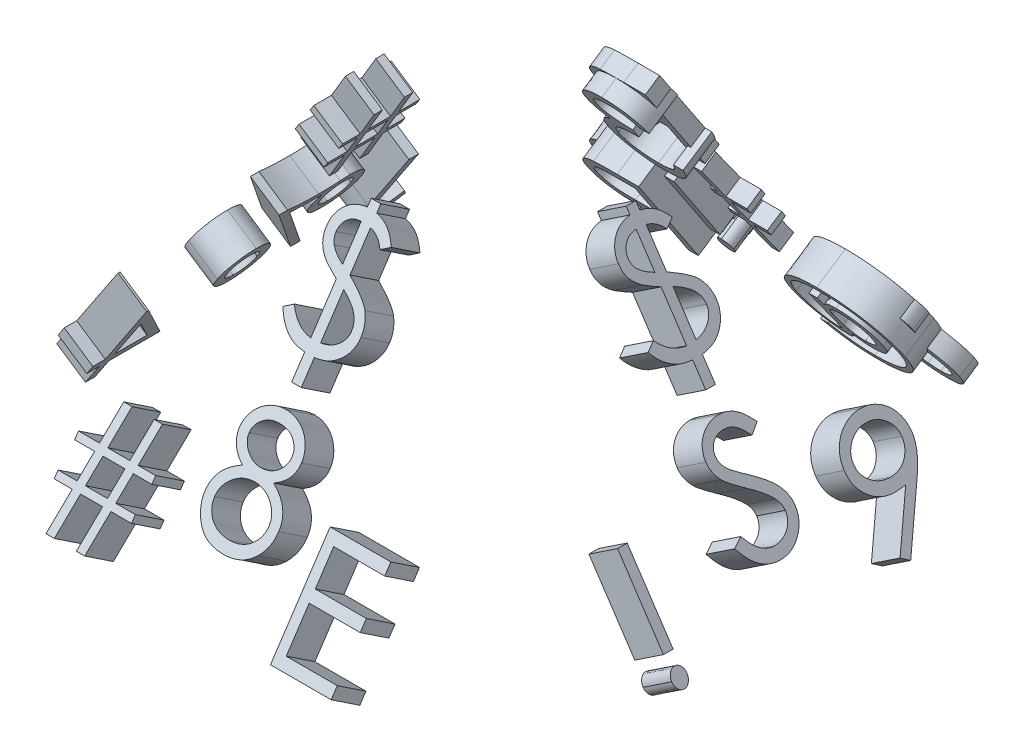
from build123d import *

# Parameters (mm, degrees)
SHELL2_T                   = -2.54
SKETCH8_W                  = 95.49459984
SKETCH8_H                  = 95.49459984
BOSS_EXTRUDE1_DEPTH        = 2.54
SKETCH9_R                  = 5.715
CUT_EXTRUDE1_DEPTH         = 2.54
LABLE_1_4_1_DEPTH          = 2.54
LABLE_1_4_1_DEPTH_BACK     = 2.54
CUT_EXTRUDE2_DEPTH         = 113.935012113
CUT_EXTRUDE2_TAPER         = -20
BOSS_EXTRUDE2_DEPTH        = 2.54
BOSS_EXTRUDE2_DEPTH_BACK   = 2.54
BOSS_EXTRUDE2_2_DEPTH      = 2.54
BOSS_EXTRUDE2_2_DEPTH_BACK = 2.54
SKETCH21_W                 = 1.424679487
SKETCH21_H                 = 12.211538461
BOSS_EXTRUDE2_3_DEPTH      = 2.54
BOSS_EXTRUDE2_3_DEPTH_BACK = 2.54
BOSS_EXTRUDE2_4_DEPTH      = 2.54
BOSS_EXTRUDE2_4_DEPTH_BACK = 2.54
BOSS_EXTRUDE2_5_DEPTH      = 2.54
BOSS_EXTRUDE2_5_DEPTH_BACK = 2.54
BOSS_EXTRUDE3_DEPTH        = 2.54
BOSS_EXTRUDE3_DEPTH_BACK   = 2.54
BOSS_EXTRUDE3_2_DEPTH      = 2.54
BOSS_EXTRUDE3_2_DEPTH_BACK = 2.54
BOSS_EXTRUDE3_3_DEPTH      = 2.54
BOSS_EXTRUDE3_3_DEPTH_BACK = 2.54
BOSS_EXTRUDE3_4_DEPTH      = 2.54
BOSS_EXTRUDE3_4_DEPTH_BACK = 2.54
BOSS_EXTRUDE3_5_DEPTH      = 2.54
BOSS_EXTRUDE3_5_DEPTH_BACK = 2.54
BOSS_EXTRUDE4_DEPTH        = 2.54
BOSS_EXTRUDE4_DEPTH_BACK   = 2.54
BOSS_EXTRUDE4_2_DEPTH      = 2.54
BOSS_EXTRUDE4_2_DEPTH_BACK = 2.54
BOSS_EXTRUDE4_3_DEPTH      = 2.54
BOSS_EXTRUDE4_3_DEPTH_BACK = 2.54
BOSS_EXTRUDE4_4_DEPTH      = 2.54
BOSS_EXTRUDE4_4_DEPTH_BACK = 2.54
BOSS_EXTRUDE5_DEPTH        = 2.54
BOSS_EXTRUDE5_DEPTH_BACK   = 2.54
BOSS_EXTRUDE5_2_DEPTH      = 2.54
BOSS_EXTRUDE5_2_DEPTH_BACK = 2.54
SKETCH24_W                 = 1.424679487
SKETCH24_H                 = 12.211538461
BOSS_EXTRUDE5_3_DEPTH      = 2.54
BOSS_EXTRUDE5_3_DEPTH_BACK = 2.54
BOSS_EXTRUDE5_4_DEPTH      = 2.54
BOSS_EXTRUDE5_4_DEPTH_BACK = 2.54
BOSS_EXTRUDE5_5_DEPTH      = 2.54
BOSS_EXTRUDE5_5_DEPTH_BACK = 2.54


with BuildPart() as part:
    # Sketch3 → Loft1 section 0
    with BuildSketch(Plane(origin=(0, 0, 0), x_dir=(1, 0, 0), z_dir=(0, 1, 0)), mode=Mode.PRIVATE) as loft1_s0:
        with BuildLine():
            Line((-50.8, -50.8), (50.8, -50.8))
            Line((50.8, -50.8), (50.8, 50.8))
            Line((50.8, 50.8), (-50.8, 50.8))
            Line((-50.8, 50.8), (-50.8, -50.8))
        make_face()
    loft([Vertex(0, 76.2, 0), loft1_s0.sketch])

    # Shell2
    shell2_openings = [part.faces().sort_by_distance(p)[0] for p in [
        (0, 0, 0),
    ]]
    offset(amount=SHELL2_T, openings=shell2_openings, kind=Kind.INTERSECTION)

    # Sketch8 → Boss-Extrude1 (add)
    with BuildSketch(Plane.XZ):
        Rectangle(SKETCH8_W, SKETCH8_H)
    extrude(amount=-BOSS_EXTRUDE1_DEPTH)

    # Sketch9 → Cut-Extrude1 (cut)
    with BuildSketch(Plane(origin=(0, 23.446153846, -35.169230769), x_dir=(-1, 0, 0), z_dir=(0, 0.5547001962252291, -0.8320502943378436))):
        with Locations((35.4584, -19.288769968)):
            Circle(SKETCH9_R)
    extrude(amount=-CUT_EXTRUDE1_DEPTH, mode=Mode.SUBTRACT)

    # Sketch7 → lable_1_4.1 (add, two sides: drawn at the far end of the back side and taken through both)
    # profile 1 of 4: a face of its own
    with BuildSketch(Plane(origin=(0, 23.446153846, -35.169230769), x_dir=(-1, 0, 0), z_dir=(0, 0.5547001962252291, -0.8320502943378436)).offset(-LABLE_1_4_1_DEPTH_BACK)):
        with BuildLine():
            Line((-4.31474359, 32.853683778), (-1.137835537, 32.853683778))
            add(Edge.make_bspline(
                [(-1.137835537, 32.853683778), (-0.925831133, 32.852978085), (-0.518759192, 32.851623075), (0.064412427, 32.84406765), (0.59430676, 32.822412537), (1.070646746, 32.803777176), (1.493423645, 32.769795871), (1.863933857, 32.737317221), (2.180470913, 32.694800974), (2.372086024, 32.655315663), (2.458844151, 32.637437785)],
                knots=[0, 0, 0, 0, 1.410062039, 2.707475311, 3.878576406, 4.937260626, 5.877586885, 6.699081471, 7.410979367, 8, 8, 8, 8], degree=3))
            add(Edge.make_bspline(
                [(2.458844151, 32.637437785), (2.574988482, 32.608741384), (2.80479947, 32.551960757), (3.135680126, 32.431947567), (3.450977238, 32.293065698), (3.749381084, 32.129944538), (4.029396994, 31.941373216), (4.29391219, 31.730607089), (4.54412697, 31.498799406), (4.769922221, 31.240105661), (4.982824349, 30.968704349), (5.162387047, 30.675226595), (5.317175009, 30.368333238), (5.440412711, 30.044903164), (5.539644948, 29.708072985), (5.609613962, 29.354791657), (5.651574706, 28.986668663), (5.655846694, 28.735581005), (5.658012821, 28.60826611)],
                knots=[0, 0, 0, 0, 1.027469482, 2.033020251, 3.019912614, 3.986113645, 4.951240523, 5.91722682, 6.890402269, 7.87763091, 8.8651537, 9.85103654, 10.82876324, 11.815024772, 12.821070561, 13.842952187, 14.906261191, 16, 16, 16, 16], degree=3))
            add(Edge.make_bspline(
                [(5.658012821, 28.60826611), (5.651349865, 28.3967426), (5.638348712, 27.984005445), (5.517131278, 27.385015019), (5.318573492, 26.826263485), (5.044964288, 26.308454377), (4.696533095, 25.841681093), (4.277774221, 25.431695813), (3.788454055, 25.088614781), (3.332935372, 24.850703846), (2.930553109, 24.69833601), (2.599294868, 24.591128239), (2.237948221, 24.508297183), (1.84997531, 24.434092299), (1.433761587, 24.378068542), (0.990304623, 24.337035775), (0.519288149, 24.311390625), (0.195714513, 24.307571532), (0.029256811, 24.305606855)],
                knots=[0, 0, 0, 0, 1.260483769, 2.459530307, 3.627416485, 4.787058657, 5.939039949, 7.08810263, 8.267026773, 9.491475466, 10.141966685, 10.831826277, 11.566392101, 12.351337768, 13.187381173, 14.07005841, 15.007169909, 16, 16, 16, 16], degree=3))
            Line((0.029256811, 24.305606855), (5.861538462, 16.978683778))
            Line((5.861538462, 16.978683778), (4.099769631, 16.978683778))
            Line((4.099769631, 16.978683778), (-1.732512019, 24.305606855))
            Line((-1.732512019, 24.305606855), (-2.890064103, 24.305606855))
            Line((-2.890064103, 24.305606855), (-2.890064103, 16.978683778))
            Line((-2.890064103, 16.978683778), (-4.31474359, 16.978683778))
            Line((-4.31474359, 16.978683778), (-4.31474359, 32.853683778))
        make_face()
        with BuildLine():
            Line((-2.890064103, 31.22547865), (-2.890064103, 25.933811983))
            Line((-2.890064103, 25.933811983), (0.016536458, 25.911551366))
            add(Edge.make_bspline(
                [(0.016536458, 25.911551366), (0.152245206, 25.911491329), (0.415287412, 25.911374958), (0.795836856, 25.929489586), (1.150167362, 25.95009678), (1.476923631, 25.981617026), (1.776251633, 26.022239208), (2.048001758, 26.073052744), (2.2926176, 26.132253171), (2.5779074, 26.223881974), (2.896480238, 26.369052128), (3.242697931, 26.580259926), (3.537529963, 26.845912716), (3.786621696, 27.149685177), (3.986780189, 27.483678163), (4.127895578, 27.843888124), (4.217441655, 28.221221443), (4.228003272, 28.480565004), (4.233333333, 28.611446198)],
                knots=[0, 0, 0, 0, 1.146690395, 2.22261258, 3.21895312, 4.145990853, 4.996080663, 5.770904154, 6.481378293, 7.121626537, 8.300444488, 9.431385265, 10.535395872, 11.636531494, 12.74115979, 13.810798291, 14.895190096, 16, 16, 16, 16], degree=3))
            add(Edge.make_bspline(
                [(4.233333333, 28.611446198), (4.227880856, 28.739111015), (4.217076034, 28.992096097), (4.128861977, 29.362463976), (3.97968514, 29.712017643), (3.778652132, 30.039335128), (3.533727394, 30.33645043), (3.246535886, 30.590664303), (2.92493018, 30.80043866), (2.624342958, 30.934488886), (2.355673495, 31.016675364), (2.122403251, 31.074510999), (1.858826191, 31.120976984), (1.563662504, 31.158206402), (1.23817225, 31.190205614), (0.880709654, 31.211758324), (0.493646401, 31.224521208), (0.22537282, 31.225152075), (0.086498397, 31.22547865)],
                knots=[0, 0, 0, 0, 1.101028733, 2.181837193, 3.264309656, 4.369019818, 5.486613113, 6.575447106, 7.666700264, 8.788928104, 9.402425223, 10.0903467, 10.862060571, 11.710948788, 12.657782767, 13.684531032, 14.801375019, 16, 16, 16, 16], degree=3))
            Line((0.086498397, 31.22547865), (-2.890064103, 31.22547865))
        make_face(mode=Mode.SUBTRACT)
    # profile 2 of 4: a face of its own
    with BuildSketch(Plane(origin=(0, 23.446153846, -35.169230769), x_dir=(-1, 0, 0), z_dir=(0, 0.5547001962252291, -0.8320502943378436)).offset(-LABLE_1_4_1_DEPTH_BACK)):
        with BuildLine():
            Line((17.679584518, -17.15582125), (16.541112963, -16.363979303))
            Line((16.541112963, -16.363979303), (20.955075303, -9.911580465))
            add(Edge.make_bspline(
                [(20.955075303, -9.911580465), (20.673449466, -9.946020431), (20.118912493, -10.013834644), (19.56039778, -10.026292685), (19.285529029, -10.032423814)],
                knots=[0, 0, 0, 0, 1.015715272, 2, 2, 2, 2], degree=3))
            add(Edge.make_bspline(
                [(19.285529029, -10.032423814), (19.118877598, -10.02815536), (18.791755412, -10.019776759), (18.31082613, -9.9533657), (17.848702338, -9.851084763), (17.406609188, -9.698463624), (16.982885005, -9.508788176), (16.578454805, -9.273579578), (16.193863016, -8.99687247), (15.833240121, -8.680129973), (15.505254734, -8.332340235), (15.213049062, -7.964241426), (14.970201785, -7.571557559), (14.768468701, -7.162299063), (14.615477001, -6.73058365), (14.504068348, -6.281323871), (14.435477669, -5.811371066), (14.427317486, -5.491489223), (14.423174261, -5.329073454)],
                knots=[0, 0, 0, 0, 1.060718605, 2.082097864, 3.085795603, 4.069760067, 5.054557537, 6.03741023, 7.043284206, 8.066802108, 9.088538119, 10.083643548, 11.053783639, 12.022749082, 12.983451788, 13.964007469, 14.966251758, 16, 16, 16, 16], degree=3))
            add(Edge.make_bspline(
                [(14.423174261, -5.329073454), (14.431041162, -5.106965636), (14.446482292, -4.671013047), (14.570754138, -4.034045594), (14.775134962, -3.431763771), (15.060106528, -2.865751106), (15.419039015, -2.344149682), (15.850424406, -1.874210633), (16.351638815, -1.462617903), (16.911264402, -1.108813695), (17.516115603, -0.824265672), (18.149612731, -0.614537416), (18.806901776, -0.491171667), (19.25216228, -0.474907225), (19.476334317, -0.466718686)],
                knots=[0, 0, 0, 0, 1.022988612, 2.007919123, 2.978103895, 3.94594894, 4.918897164, 5.887013414, 6.875921846, 7.89917871, 8.930658928, 9.948724884, 10.967259574, 12, 12, 12, 12], degree=3))
            add(Edge.make_bspline(
                [(19.476334317, -0.466718686), (19.696263935, -0.475019783), (20.130824129, -0.491421968), (20.769856409, -0.611545684), (21.381910307, -0.814004879), (21.963592925, -1.093788436), (22.502160974, -1.444493982), (22.986465546, -1.862389857), (23.405454598, -2.347736356), (23.758441486, -2.888794864), (24.04178774, -3.470123672), (24.246222738, -4.07692932), (24.372069029, -4.704847806), (24.38792737, -5.130272742), (24.395930671, -5.344973895)],
                knots=[0, 0, 0, 0, 1.026385292, 2.028040595, 3.023318987, 4.028184125, 5.03290303, 6.015178782, 7.004435299, 8.016004309, 9.023023918, 10.015172535, 10.998308025, 12, 12, 12, 12], degree=3))
            add(Edge.make_bspline(
                [(24.395930671, -5.344973895), (24.390585745, -5.511633124), (24.379744899, -5.849659684), (24.303833792, -6.363240167), (24.174927952, -6.886893958), (24.028643461, -7.330131196), (23.887436844, -7.696201664), (23.754535282, -7.985360616), (23.607069443, -8.289712775), (23.435080757, -8.606066772), (23.250194625, -8.938455413), (23.041282907, -9.283544874), (22.813111206, -9.641798235), (22.650597834, -9.883311813), (22.56737999, -10.006983109)],
                knots=[0, 0, 0, 0, 1.179839688, 2.393009684, 3.667231171, 4.993948276, 5.694988576, 6.444077775, 7.246288328, 8.089075292, 8.993003841, 9.939041771, 10.944649915, 12, 12, 12, 12], degree=3))
            Line((22.56737999, -10.006983109), (17.679584518, -17.15582125))
        make_face()
        with BuildLine():
            add(Edge.make_bspline(
                [(19.549476344, -8.404218686), (19.67572348, -8.400769803), (19.921483734, -8.394055999), (20.281516483, -8.353192652), (20.621351263, -8.280739215), (20.941895858, -8.176781949), (21.246364306, -8.051339201), (21.529920509, -7.891627693), (21.792801778, -7.701052242), (22.036768448, -7.486921099), (22.253412304, -7.249020238), (22.446375336, -7.000022647), (22.610389338, -6.738835309), (22.739944202, -6.462187298), (22.846463526, -6.176812817), (22.920023795, -5.878116277), (22.960774164, -5.567653888), (22.96772095, -5.356749261), (22.971251184, -5.24957125)],
                knots=[0, 0, 0, 0, 1.163407946, 2.26475976, 3.333800367, 4.359385343, 5.366239384, 6.363380779, 7.350133999, 8.353570782, 9.349036268, 10.310270964, 11.253520213, 12.184142, 13.120487599, 14.056272588, 15.012232024, 16, 16, 16, 16], degree=3))
            add(Edge.make_bspline(
                [(22.971251184, -5.24957125), (22.968213756, -5.142348483), (22.962228132, -4.931052868), (22.914207165, -4.620130834), (22.829728474, -4.322164972), (22.716378776, -4.035524022), (22.567061983, -3.76256305), (22.387885458, -3.49985506), (22.175013275, -3.249065766), (21.930073065, -3.016093412), (21.665937771, -2.801336869), (21.384449073, -2.611807167), (21.087927133, -2.452961026), (20.778180982, -2.321883556), (20.454565257, -2.219595145), (20.117271453, -2.146037812), (19.764595149, -2.105344497), (19.525194316, -2.098441618), (19.40319229, -2.094923814)],
                knots=[0, 0, 0, 0, 0.972161553, 1.915763587, 2.844109794, 3.775983486, 4.705125789, 5.659731448, 6.655561913, 7.682237399, 8.721216875, 9.739758359, 10.754845918, 11.767244016, 12.7857855, 13.828538656, 14.893392813, 16, 16, 16, 16], degree=3))
            add(Edge.make_bspline(
                [(19.40319229, -2.094923814), (19.282251309, -2.098447301), (19.044966099, -2.105360353), (18.69542509, -2.145960462), (18.360411936, -2.220089837), (18.037733873, -2.321836176), (17.727996926, -2.452970804), (17.431488971, -2.61181549), (17.149934431, -2.801293241), (16.886052376, -3.016262388), (16.640679658, -3.247981354), (16.431467437, -3.500953692), (16.251880855, -3.762426393), (16.102769235, -4.035560341), (15.98936496, -4.322155279), (15.904900882, -4.620133459), (15.856875989, -4.931052184), (15.850890903, -5.142348253), (15.847853748, -5.24957125)],
                knots=[0, 0, 0, 0, 1.099389452, 2.15699305, 3.192601482, 4.213358962, 5.227959689, 6.245255729, 7.266013209, 8.307253147, 9.336162325, 10.327954924, 11.284637477, 12.215801273, 13.149702402, 14.080068371, 15.025723358, 16, 16, 16, 16], degree=3))
            add(Edge.make_bspline(
                [(15.847853748, -5.24957125), (15.850602056, -5.356832723), (15.856022222, -5.568371979), (15.908308982, -5.879188119), (15.995749752, -6.177130998), (16.11285913, -6.465097634), (16.267080629, -6.740287847), (16.456328082, -7.001396953), (16.678149666, -7.251384888), (16.929580128, -7.486367599), (17.204753572, -7.702050681), (17.498653099, -7.890420628), (17.806219145, -8.049499215), (18.128534399, -8.177140492), (18.463210241, -8.279700537), (18.813254587, -8.353059118), (19.177509807, -8.393664042), (19.424297939, -8.400666717), (19.549476344, -8.404218686)],
                knots=[0, 0, 0, 0, 0.952633368, 1.87876736, 2.791047057, 3.707742249, 4.635551637, 5.587206343, 6.568248508, 7.601284464, 8.641511608, 9.671105535, 10.699146789, 11.713763218, 12.747829548, 13.806491675, 14.887386225, 16, 16, 16, 16], degree=3))
        make_face(mode=Mode.SUBTRACT)
    # profile 3 of 4: a face of its own
    with BuildSketch(Plane(origin=(0, 23.446153846, -35.169230769), x_dir=(-1, 0, 0), z_dir=(0, 0.5547001962252291, -0.8320502943378436)).offset(-LABLE_1_4_1_DEPTH_BACK)):
        with BuildLine():
            Line((-13.202707314, -10.846526378), (-12.30274237, -11.889595289))
            add(Edge.make_bspline(
                [(-12.30274237, -11.889595289), (-12.472378651, -12.02736025), (-12.806382515, -12.298611359), (-13.296630608, -12.69785384), (-13.76962254, -13.080012078), (-14.076300649, -13.331076553), (-14.226695695, -13.454198654)],
                knots=[0, 0, 0, 0, 1.057475972, 2.082108015, 3.059465138, 4, 4, 4, 4], degree=3))
            add(Edge.make_bspline(
                [(-14.226695695, -13.454198654), (-14.094043099, -13.588676197), (-13.817679373, -13.868841954), (-13.389580656, -14.308866376), (-12.923991304, -14.778263378), (-12.604659536, -15.104476392), (-12.43948616, -15.273209071)],
                knots=[0, 0, 0, 0, 0.888881212, 1.851863672, 2.888883089, 4, 4, 4, 4], degree=3))
            add(Edge.make_bspline(
                [(-12.43948616, -15.273209071), (-12.308015441, -15.40674623), (-12.052435878, -15.666342959), (-11.679506084, -16.046029556), (-11.327448523, -16.40315955), (-11.101574339, -16.636255686), (-10.992546056, -16.748769968)],
                knots=[0, 0, 0, 0, 1.088118532, 2.115306442, 3.090268309, 4, 4, 4, 4], degree=3))
            Line((-10.992546056, -16.748769968), (-12.906959117, -16.748769968))
            Line((-12.906959117, -16.748769968), (-15.292025223, -14.319182628))
            add(Edge.make_bspline(
                [(-15.292025223, -14.319182628), (-15.462045693, -14.45674449), (-15.79014466, -14.722206082), (-16.275858018, -15.093516409), (-16.728340986, -15.434847711), (-17.154312451, -15.73759783), (-17.553978621, -16.00236696), (-17.923003137, -16.234316393), (-18.265197861, -16.430519113), (-18.681212095, -16.641946693), (-19.194809896, -16.847339905), (-19.820543278, -17.027961415), (-20.465462004, -17.135964486), (-20.901298892, -17.149163777), (-21.121126785, -17.15582125)],
                knots=[0, 0, 0, 0, 1.188070381, 2.29269255, 3.321212884, 4.267145447, 5.131232476, 5.925402657, 6.634692834, 7.273399376, 8.459346405, 9.633235643, 10.80624877, 12, 12, 12, 12], degree=3))
            add(Edge.make_bspline(
                [(-21.121126785, -17.15582125), (-21.265464953, -17.153240504), (-21.54766804, -17.148194753), (-21.95923552, -17.09497781), (-22.349537906, -17.014269377), (-22.716801793, -16.895666418), (-23.062573938, -16.744856018), (-23.388829047, -16.565070472), (-23.690069823, -16.345032305), (-23.96819288, -16.095686074), (-24.216991776, -15.820556379), (-24.436558299, -15.528539992), (-24.621793785, -15.218248543), (-24.774170065, -14.891152931), (-24.893376369, -14.548169435), (-24.974846503, -14.188668628), (-25.027961496, -13.813019425), (-25.033168533, -13.556146964), (-25.035815287, -13.425577861)],
                knots=[0, 0, 0, 0, 1.140827302, 2.230491023, 3.276155818, 4.288841946, 5.276195931, 6.25568983, 7.228235982, 8.219567526, 9.204677076, 10.15696153, 11.104363201, 12.056942777, 13.006011855, 13.969848463, 14.968067402, 16, 16, 16, 16], degree=3))
            add(Edge.make_bspline(
                [(-25.035815287, -13.425577861), (-25.025982644, -13.223457677), (-25.006150275, -12.815782765), (-24.862550224, -12.205593746), (-24.625145598, -11.60003092), (-24.360469415, -11.094101138), (-24.082144841, -10.686481196), (-23.829006534, -10.351013185), (-23.518308455, -10.002756021), (-23.168406211, -9.627314169), (-22.764120576, -9.237109578), (-22.316477104, -8.823686621), (-21.819973672, -8.391247286), (-21.46849859, -8.102282944), (-21.286491368, -7.95264617)],
                knots=[0, 0, 0, 0, 1.059627018, 2.137259838, 3.268884587, 4.465199172, 5.122089581, 5.855989104, 6.667703162, 7.568389345, 8.547351898, 9.613609101, 10.764235646, 12, 12, 12, 12], degree=3))
            add(Edge.make_bspline(
                [(-21.286491368, -7.95264617), (-21.384423366, -7.828941639), (-21.57250012, -7.591369165), (-21.83644782, -7.244658354), (-22.073225343, -6.92259375), (-22.281278179, -6.624430089), (-22.467159393, -6.354705606), (-22.624925483, -6.1096725), (-22.750494937, -5.887399596), (-22.887163145, -5.631961448), (-23.012887564, -5.329028684), (-23.12304623, -4.974759297), (-23.189868359, -4.627724593), (-23.199398807, -4.398637019), (-23.204084518, -4.286004544)],
                knots=[0, 0, 0, 0, 1.347531222, 2.587911062, 3.721495934, 4.761363145, 5.693007242, 6.519321152, 7.249247836, 7.872897469, 8.99276919, 10.043809027, 11.038225309, 12, 12, 12, 12], degree=3))
            add(Edge.make_bspline(
                [(-23.204084518, -4.286004544), (-23.202327868, -4.191451803), (-23.198872631, -4.0054715), (-23.1511311, -3.734016939), (-23.081745699, -3.473596238), (-22.984045897, -3.225043817), (-22.853217251, -2.9915776), (-22.702335953, -2.766287554), (-22.514482459, -2.559734678), (-22.375139583, -2.433003499), (-22.304119574, -2.368411395)],
                knots=[0, 0, 0, 0, 1.03459038, 2.034985263, 3.00970721, 3.984429156, 4.951093115, 5.936753036, 6.948408246, 8, 8, 8, 8], degree=3))
            add(Edge.make_bspline(
                [(-22.304119574, -2.368411395), (-22.216237308, -2.297986172), (-22.040906206, -2.157483061), (-21.757092689, -1.973989615), (-21.452267714, -1.828049143), (-21.137928612, -1.696549581), (-20.804118897, -1.603664371), (-20.456857373, -1.53269574), (-20.092871, -1.49070014), (-19.844958782, -1.486490617), (-19.718707915, -1.484346891)],
                knots=[0, 0, 0, 0, 0.967861857, 1.93095028, 2.896793832, 3.869789818, 4.856135748, 5.869432465, 6.914994986, 8, 8, 8, 8], degree=3))
            add(Edge.make_bspline(
                [(-19.718707915, -1.484346891), (-19.559433492, -1.489396769), (-19.245537281, -1.49934901), (-18.786274974, -1.573130771), (-18.348367961, -1.697868905), (-17.939071955, -1.873120061), (-17.559003131, -2.082629943), (-17.226807768, -2.336287264), (-16.938652832, -2.621071448), (-16.704668877, -2.940832467), (-16.517290888, -3.278611691), (-16.380951783, -3.630181666), (-16.29812118, -3.992745268), (-16.288856104, -4.238940764), (-16.284212723, -4.362326659)],
                knots=[0, 0, 0, 0, 1.150236937, 2.266873792, 3.350248666, 4.431131026, 5.476858895, 6.476929332, 7.440723444, 8.393319161, 9.328959997, 10.223430523, 11.109635963, 12, 12, 12, 12], degree=3))
            add(Edge.make_bspline(
                [(-16.284212723, -4.362326659), (-16.290924742, -4.496620608), (-16.304832536, -4.774887472), (-16.425619123, -5.193138772), (-16.609661039, -5.624735062), (-16.822966567, -5.987998201), (-17.038193266, -6.289559763), (-17.238335379, -6.536483977), (-17.472572913, -6.798868388), (-17.74572517, -7.076341716), (-18.052404236, -7.369868924), (-18.394498874, -7.679998521), (-18.772922431, -8.003382611), (-19.03985058, -8.221363981), (-19.178092931, -8.334256747)],
                knots=[0, 0, 0, 0, 0.95228837, 1.973211012, 3.069609294, 4.280899273, 4.9557195, 5.700045445, 6.53727831, 7.453060125, 8.46483533, 9.552225843, 10.73229536, 12, 12, 12, 12], degree=3))
            Line((-19.178092931, -8.334256747), (-16.786666649, -10.846526378))
            Line((-16.786666649, -10.846526378), (-15.196622578, -12.46837133))
            add(Edge.make_bspline(
                [(-15.196622578, -12.46837133), (-15.00480915, -12.312483327), (-14.638141041, -12.014489803), (-14.113401922, -11.58968909), (-13.642361584, -11.202771858), (-13.343811932, -10.960861405), (-13.202707314, -10.846526378)],
                knots=[0, 0, 0, 0, 1.154001856, 2.20597526, 3.152083497, 4, 4, 4, 4], degree=3))
        make_face()
        with BuildLine():
            add(Edge.make_bspline(
                [(-20.15437999, -7.154444047), (-19.946544838, -7.014306653), (-19.54974023, -6.746752472), (-19.016072773, -6.317377592), (-18.552093944, -5.902453711), (-18.297439084, -5.602207217), (-18.176365167, -5.459457068)],
                knots=[0, 0, 0, 0, 1.149778042, 2.195187973, 3.141914424, 4, 4, 4, 4], degree=3))
            add(Edge.make_bspline(
                [(-18.176365167, -5.459457068), (-18.10570238, -5.365827728), (-17.972634796, -5.189511019), (-17.828043012, -4.91566537), (-17.726742857, -4.659720365), (-17.714632749, -4.490325854), (-17.70889221, -4.410027981)],
                knots=[0, 0, 0, 0, 1.202613574, 2.264683996, 3.177410281, 4, 4, 4, 4], degree=3))
            add(Edge.make_bspline(
                [(-17.70889221, -4.410027981), (-17.715638867, -4.32414824), (-17.729231291, -4.151127148), (-17.842763567, -3.903884206), (-18.028395934, -3.681755596), (-18.278176794, -3.484077658), (-18.58246664, -3.316233661), (-18.938395755, -3.195104023), (-19.340871057, -3.127092085), (-19.624100589, -3.117557027), (-19.772769413, -3.11255202)],
                knots=[0, 0, 0, 0, 0.764515178, 1.54026142, 2.381579227, 3.330821025, 4.368998387, 5.470797668, 6.672407028, 8, 8, 8, 8], degree=3))
            add(Edge.make_bspline(
                [(-19.772769413, -3.11255202), (-19.914054081, -3.117396769), (-20.185941385, -3.126719974), (-20.573764848, -3.198513514), (-20.920398456, -3.324226911), (-21.221023988, -3.493406096), (-21.466347715, -3.696702002), (-21.646212692, -3.925689206), (-21.759242149, -4.176709543), (-21.772712087, -4.353824147), (-21.77940503, -4.441828862)],
                knots=[0, 0, 0, 0, 1.27617104, 2.455855338, 3.546649981, 4.593280411, 5.55842324, 6.40519289, 7.207572142, 8, 8, 8, 8], degree=3))
            add(Edge.make_bspline(
                [(-21.77940503, -4.441828862), (-21.776864671, -4.509821779), (-21.771783644, -4.645815881), (-21.733673968, -4.846502264), (-21.665457113, -5.039178607), (-21.603752952, -5.160096504), (-21.572699301, -5.220950457)],
                knots=[0, 0, 0, 0, 1.001046439, 2.002214593, 2.994581098, 4, 4, 4, 4], degree=3))
            add(Edge.make_bspline(
                [(-21.572699301, -5.220950457), (-21.482405103, -5.372717724), (-21.293589586, -5.690080476), (-20.959329094, -6.160072022), (-20.580909748, -6.656405738), (-20.300259205, -6.984107896), (-20.15437999, -7.154444047)],
                knots=[0, 0, 0, 0, 0.882093017, 1.844557613, 2.879623611, 4, 4, 4, 4], degree=3))
        make_face(mode=Mode.SUBTRACT)
        with BuildLine():
            add(Edge.make_bspline(
                [(-20.246602546, -9.145179223), (-20.412588304, -9.271589842), (-20.732149124, -9.514959404), (-21.182461399, -9.878181113), (-21.592426587, -10.217387603), (-21.953539315, -10.541645484), (-22.272110471, -10.843421005), (-22.548828047, -11.122902486), (-22.777249649, -11.38609566), (-23.018680691, -11.7000422), (-23.249194563, -12.076687211), (-23.453657395, -12.517581981), (-23.583936095, -12.944420711), (-23.602314718, -13.226559552), (-23.6111358, -13.361976098)],
                knots=[0, 0, 0, 0, 1.348995177, 2.597126469, 3.74061818, 4.789100084, 5.734499531, 6.577865258, 7.330979068, 7.986257854, 9.13712093, 10.176896549, 11.124975592, 12, 12, 12, 12], degree=3))
            add(Edge.make_bspline(
                [(-23.6111358, -13.361976098), (-23.608368493, -13.438403726), (-23.60284401, -13.590979216), (-23.56836452, -13.81650542), (-23.506217998, -14.034421275), (-23.42382576, -14.246244391), (-23.314366161, -14.450700328), (-23.180834353, -14.64765304), (-23.021934024, -14.836002866), (-22.8469449, -15.0192953), (-22.652096516, -15.187217377), (-22.439821479, -15.32954688), (-22.220561212, -15.454545264), (-21.990267591, -15.558529213), (-21.746909578, -15.632252645), (-21.495659659, -15.691969008), (-21.232101647, -15.722381245), (-21.053346535, -15.728181644), (-20.962122378, -15.731141763)],
                knots=[0, 0, 0, 0, 0.93114453, 1.858880562, 2.770572272, 3.686551743, 4.622340414, 5.589324723, 6.57965016, 7.620701392, 8.673933733, 9.705411322, 10.728856044, 11.746254978, 12.775385999, 13.821629539, 14.888311458, 16, 16, 16, 16], degree=3))
            add(Edge.make_bspline(
                [(-20.962122378, -15.731141763), (-20.821878698, -15.727162088), (-20.540702765, -15.719183198), (-20.123238634, -15.644715989), (-19.708324652, -15.532499885), (-19.4430146, -15.419535495), (-19.308476545, -15.362251539)],
                knots=[0, 0, 0, 0, 0.985107723, 1.975052154, 2.97315407, 4, 4, 4, 4], degree=3))
            add(Edge.make_bspline(
                [(-19.308476545, -15.362251539), (-19.198628871, -15.310544498), (-18.971551947, -15.203655792), (-18.631687204, -15.011633867), (-18.272005248, -14.801202869), (-17.900745019, -14.557102289), (-17.512639006, -14.289992738), (-17.10797873, -13.99715562), (-16.689040613, -13.675689336), (-16.406758753, -13.449425493), (-16.261952106, -13.333355305)],
                knots=[0, 0, 0, 0, 0.793866152, 1.641078755, 2.55195156, 3.519315084, 4.546339611, 5.633686856, 6.786114446, 8, 8, 8, 8], degree=3))
            Line((-16.261952106, -13.333355305), (-18.809202707, -10.735223294))
            add(Edge.make_bspline(
                [(-18.809202707, -10.735223294), (-18.919885965, -10.617966308), (-19.149561079, -10.374650275), (-19.496662293, -9.98946598), (-19.868026748, -9.579308837), (-20.117748935, -9.292941359), (-20.246602546, -9.145179223)],
                knots=[0, 0, 0, 0, 0.902632658, 1.873022723, 2.90250559, 4, 4, 4, 4], degree=3))
        make_face(mode=Mode.SUBTRACT)
    # profile 4 of 4: a face of its own
    with BuildSketch(Plane(origin=(0, 23.446153846, -35.169230769), x_dir=(-1, 0, 0), z_dir=(0, 0.5547001962252291, -0.8320502943378436)).offset(-LABLE_1_4_1_DEPTH_BACK)):
        Polygon((5.812692308, 2.702820513), (5.812692308, 1.685192308), (2.778888221, 1.685192308), (1.955245393, -3.81), (0.724551282, -3.81), (1.548194111, 1.685192308), (-1.698675881, 1.685192308), (-2.52231871, -3.81), (-3.753012821, -3.81), (-2.929369992, 1.685192308), (-5.58474359, 1.685192308), (-5.58474359, 2.702820513), (-2.776725761, 2.702820513), (-2.226570513, 6.366282051), (-5.177692308, 6.366282051), (-5.177692308, 7.383910256), (-2.073926282, 7.383910256), (-1.310705128, 12.472051282), (-0.083191106, 12.472051282), (-0.84641226, 7.383910256), (2.403637821, 7.383910256), (3.166858974, 12.472051282), (4.394372997, 12.472051282), (3.631151843, 7.383910256), (6.21974359, 7.383910256), (6.21974359, 6.366282051), (3.478507612, 6.366282051), (2.931532452, 2.702820513), align=None)
        Polygon((2.25099359, 6.366282051), (-0.99905649, 6.366282051), (-1.546031651, 2.702820513), (1.700838341, 2.702820513), align=None, mode=Mode.SUBTRACT)
    extrude(amount=LABLE_1_4_1_DEPTH + LABLE_1_4_1_DEPTH_BACK)

    # Sketch10 → Cut-Extrude2 (cut, through all)
    with BuildSketch(Plane(origin=(0, 23.446153846, -35.169230769), x_dir=(-1, 0, 0), z_dir=(0, 0.5547001962252291, -0.8320502943378437))):
        Polygon((0, 63.402232429), (-50.8, -28.178769968), (50.8, -28.178769968), align=None)
    extrude(amount=-CUT_EXTRUDE2_DEPTH, taper=CUT_EXTRUDE2_TAPER, mode=Mode.SUBTRACT)


with BuildPart() as cut_extrude2_piece_1:
    # of the separate pieces the step leaves, piece 1, a body of its own (cut_extrude2_pieces)
    add(part.part.solids().sort_by_distance((15.196622578, 13.071841811, -42.085438793))[0])


with BuildPart() as cut_extrude2_piece_2:
    # of the separate pieces the step leaves, piece 2, a body of its own (cut_extrude2_pieces)
    add(part.part.solids().sort_by_distance((-5.658012821, 47.249670083, -19.300219944))[0])


with BuildPart() as cut_extrude2_piece_3:
    # of the separate pieces the step leaves, piece 3, a body of its own (cut_extrude2_pieces)
    add(part.part.solids().sort_by_distance((-5.812692308, 25.695036449, -33.6699757))[0])


with BuildPart() as cut_extrude2_piece_4:
    # of the separate pieces the step leaves, piece 4, a body of its own (cut_extrude2_pieces)
    add(part.part.solids().sort_by_distance((-24.395930671, 18.998866744, -38.134088837))[0])


with BuildPart() as body_5:
    # Sketch21 → Boss-Extrude2 (new, two sides: drawn at the far end of the back side and taken through both)
    with BuildSketch(Plane(origin=(0, 23.446153846, -35.169230769), x_dir=(-1, 0, 0), z_dir=(0, 0.5547001962252291, -0.8320502943378437)).offset(-BOSS_EXTRUDE2_DEPTH_BACK)):
        with BuildLine():
            Line((-3.263852465, 28.702542063), (-4.688531952, 28.702542063))
            add(Edge.make_bspline(
                [(-4.688531952, 28.702542063), (-4.649935061, 28.862346543), (-4.574481297, 29.174751233), (-4.417103018, 29.621098451), (-4.245656396, 30.043480138), (-4.039784386, 30.433987329), (-3.815226822, 30.800468067), (-3.557948764, 31.134610167), (-3.279820022, 31.444911832), (-2.972185431, 31.720289731), (-2.649566144, 31.969653002), (-2.307416261, 32.18226487), (-1.952619565, 32.365163706), (-1.582717855, 32.515841186), (-1.196609862, 32.629349811), (-0.797786213, 32.711703894), (-0.385201766, 32.765185019), (-0.105132338, 32.770404552), (0.037079025, 32.773054883)],
                knots=[0, 0, 0, 0, 1.162005537, 2.271625781, 3.343758855, 4.383309926, 5.390229558, 6.379919256, 7.361854164, 8.333198761, 9.295911338, 10.242430842, 11.177959212, 12.116337295, 13.062827104, 14.020064771, 14.994644689, 16, 16, 16, 16], degree=3))
            add(Edge.make_bspline(
                [(0.037079025, 32.773054883), (0.244282891, 32.766799089), (0.654170905, 32.754423957), (1.256346154, 32.641419192), (1.837039226, 32.462598056), (2.389894029, 32.215520793), (2.903420491, 31.910778337), (3.360331052, 31.548081138), (3.754432512, 31.134427163), (4.085060582, 30.677533032), (4.343936471, 30.1892384), (4.534828236, 29.686680545), (4.651040861, 29.171051603), (4.666101958, 28.822902515), (4.673647535, 28.648480564)],
                knots=[0, 0, 0, 0, 1.083050992, 2.142477498, 3.193116406, 4.255571735, 5.30263384, 6.308962982, 7.297363603, 8.282367274, 9.249857812, 10.179914175, 11.08814088, 12, 12, 12, 12], degree=3))
            add(Edge.make_bspline(
                [(4.673647535, 28.648480564), (4.668369819, 28.480628317), (4.658042146, 28.152167516), (4.570349982, 27.672645011), (4.422774789, 27.220699181), (4.218351223, 26.794427482), (3.953730621, 26.396532673), (3.63317946, 26.026119525), (3.254435244, 25.681545129), (2.967420061, 25.484153234), (2.819656149, 25.382530043)],
                knots=[0, 0, 0, 0, 1.024540389, 2.004866551, 2.965041327, 3.920577974, 4.882998113, 5.874504559, 6.905732034, 8, 8, 8, 8], degree=3))
            add(Edge.make_bspline(
                [(2.819656149, 25.382530043), (2.98852875, 25.300986194), (3.323114215, 25.139424243), (3.779182689, 24.822578486), (4.193193052, 24.456744339), (4.424077777, 24.171254449), (4.540083833, 24.027812495)],
                knots=[0, 0, 0, 0, 1.015518401, 2.012035669, 3.001164323, 4, 4, 4, 4], degree=3))
            add(Edge.make_bspline(
                [(4.540083833, 24.027812495), (4.61647135, 23.923229122), (4.767995486, 23.715775), (4.955028086, 23.382234783), (5.12470514, 23.044997671), (5.256922206, 22.695024651), (5.359310816, 22.336372053), (5.432499248, 21.968424042), (5.477965887, 21.590880155), (5.484477141, 21.335462834), (5.487750099, 21.207074314)],
                knots=[0, 0, 0, 0, 1.025084078, 2.033381695, 3.024893161, 4.013698104, 4.991890475, 5.976764909, 6.982997093, 8, 8, 8, 8], degree=3))
            add(Edge.make_bspline(
                [(5.487750099, 21.207074314), (5.479610699, 20.984780222), (5.463370202, 20.541238156), (5.318208865, 19.885942097), (5.09317738, 19.245383569), (4.773604849, 18.632722691), (4.384134362, 18.059497392), (3.920777928, 17.546615561), (3.38880029, 17.105750463), (2.79550324, 16.737404071), (2.152714835, 16.442954924), (1.465211257, 16.238587237), (0.742898513, 16.105482167), (0.247565413, 16.091208869), (-0.00426212, 16.083952319)],
                knots=[0, 0, 0, 0, 0.955779014, 1.907060117, 2.875433937, 3.871313158, 4.872415639, 5.851225146, 6.836215519, 7.83643374, 8.849228613, 9.86973379, 10.916971861, 12, 12, 12, 12], degree=3))
            add(Edge.make_bspline(
                [(-0.00426212, 16.083952319), (-0.173985375, 16.087890286), (-0.507944145, 16.095638893), (-0.998905727, 16.148609691), (-1.467543434, 16.2453565), (-1.914490896, 16.375546493), (-2.340145168, 16.540609037), (-2.74320736, 16.746161703), (-3.126157234, 16.987967445), (-3.485381048, 17.268880504), (-3.82083598, 17.583120866), (-4.123607265, 17.93626709), (-4.398742754, 18.321791029), (-4.638875437, 18.744170605), (-4.854943044, 19.197947308), (-5.032656668, 19.688931568), (-5.189073355, 20.212734097), (-5.261796568, 20.577758133), (-5.299108875, 20.765042063)],
                knots=[0, 0, 0, 0, 1.048658725, 2.063410685, 3.046034179, 4.001477787, 4.936774919, 5.862367409, 6.792675028, 7.730719943, 8.675894397, 9.627829632, 10.600096036, 11.597688215, 12.626045268, 13.701542398, 14.82072376, 16, 16, 16, 16], degree=3))
            Line((-5.299108875, 20.765042063), (-3.874429388, 20.765042063))
            add(Edge.make_bspline(
                [(-3.874429388, 20.765042063), (-3.837312316, 20.642809038), (-3.765116387, 20.405055188), (-3.642224393, 20.062879516), (-3.50221473, 19.749198346), (-3.352016553, 19.461710614), (-3.194271459, 19.197585075), (-3.017764477, 18.963805883), (-2.835568711, 18.750104787), (-2.698230216, 18.629706011), (-2.631014925, 18.570781245)],
                knots=[0, 0, 0, 0, 1.198163088, 2.33053128, 3.407730985, 4.417276592, 5.372219308, 6.28897303, 7.162600585, 8, 8, 8, 8], degree=3))
            add(Edge.make_bspline(
                [(-2.631014925, 18.570781245), (-2.542130453, 18.502254159), (-2.364635875, 18.365411515), (-2.075401398, 18.190779129), (-1.771214236, 18.039463049), (-1.445483392, 17.923876287), (-1.105237826, 17.826006182), (-0.744977991, 17.761959542), (-0.367882256, 17.718016765), (-0.110399901, 17.71413904), (0.021178585, 17.712157447)],
                knots=[0, 0, 0, 0, 0.946170439, 1.889420265, 2.845303464, 3.807233317, 4.801018734, 5.828864929, 6.890507805, 8, 8, 8, 8], degree=3))
            add(Edge.make_bspline(
                [(0.021178585, 17.712157447), (0.169739115, 17.714951017), (0.460236406, 17.720413603), (0.884120947, 17.770649845), (1.287379727, 17.843812791), (1.665535497, 17.956810963), (2.023541727, 18.096424111), (2.356379923, 18.271722236), (2.668419405, 18.477392937), (2.955663494, 18.711159836), (3.213952046, 18.967071617), (3.441370552, 19.234738046), (3.634703838, 19.513030559), (3.790657925, 19.803489179), (3.913805064, 20.10491111), (3.997639581, 20.418142229), (4.055930382, 20.740619115), (4.060677515, 20.959825509), (4.063070612, 21.070330524)],
                knots=[0, 0, 0, 0, 1.217147791, 2.380027433, 3.494444702, 4.572153297, 5.609568379, 6.639424714, 7.649109417, 8.668170816, 9.669597737, 10.625200337, 11.543417969, 12.441394052, 13.322311151, 14.205496177, 15.095365482, 16, 16, 16, 16], degree=3))
            add(Edge.make_bspline(
                [(4.063070612, 21.070330524), (4.056129602, 21.21824624), (4.042282118, 21.513341663), (3.936561061, 21.947489232), (3.762666927, 22.365788281), (3.519223751, 22.761102043), (3.222879553, 23.127478454), (2.876510154, 23.454374106), (2.477239261, 23.724113448), (2.109756284, 23.910479854), (1.784250038, 24.037648016), (1.505687402, 24.122352319), (1.193827093, 24.194078543), (0.85244044, 24.260809203), (0.478955136, 24.317602461), (0.073777793, 24.364963554), (-0.363173697, 24.402859633), (-0.665665771, 24.419782815), (-0.821544773, 24.428503601)],
                knots=[0, 0, 0, 0, 1.07054697, 2.135767047, 3.216561865, 4.33974944, 5.486079747, 6.621378074, 7.775625952, 8.963672916, 9.598146892, 10.304877434, 11.070270905, 11.915000392, 12.823868403, 13.805723172, 14.86925407, 16, 16, 16, 16], degree=3))
            Line((-0.821544773, 24.428503601), (-0.821544773, 26.056708729))
            add(Edge.make_bspline(
                [(-0.821544773, 26.056708729), (-0.625143057, 26.060041589), (-0.240440342, 26.066569842), (0.321508826, 26.145527604), (0.85886992, 26.254750453), (1.359734072, 26.422051146), (1.816247879, 26.616362493), (2.212304645, 26.842477871), (2.542355635, 27.093823341), (2.804796923, 27.374278391), (3.002233067, 27.675064499), (3.146590327, 27.988557911), (3.231863236, 28.31750633), (3.243246368, 28.542000002), (3.248968048, 28.65484074)],
                knots=[0, 0, 0, 0, 1.321986639, 2.589447074, 3.816329219, 5.01088745, 6.139805852, 7.153945165, 8.075214402, 8.924034688, 9.728124013, 10.488707548, 11.240355623, 12, 12, 12, 12], degree=3))
            add(Edge.make_bspline(
                [(3.248968048, 28.65484074), (3.247088398, 28.73774337), (3.243348924, 28.90267422), (3.196189843, 29.143634353), (3.125323657, 29.377227929), (3.027897742, 29.602461569), (2.897495055, 29.817773168), (2.74143933, 30.024998383), (2.555619733, 30.222954095), (2.342688598, 30.407468402), (2.114035054, 30.583314584), (1.86343786, 30.732601438), (1.598452928, 30.860259398), (1.318786887, 30.965531068), (1.02353216, 31.044721411), (0.714075988, 31.101580406), (0.38982828, 31.137129769), (0.168613639, 31.142247941), (0.056159554, 31.144849755)],
                knots=[0, 0, 0, 0, 0.884392785, 1.759457502, 2.611959086, 3.489218968, 4.37281399, 5.2945488, 6.255912374, 7.266815255, 8.301784654, 9.332968512, 10.37626691, 11.440494194, 12.520033166, 13.637162961, 14.798855837, 16, 16, 16, 16], degree=3))
            add(Edge.make_bspline(
                [(0.056159554, 31.144849755), (-0.124596226, 31.138538934), (-0.477654304, 31.126212434), (-0.986629106, 31.018248766), (-1.459791799, 30.84599103), (-1.821463609, 30.640373406), (-2.088538141, 30.437398224), (-2.279387111, 30.260131686), (-2.46680514, 30.063132807), (-2.638462317, 29.834268034), (-2.81206214, 29.589036521), (-2.970107116, 29.314971965), (-3.123685006, 29.019223463), (-3.216225141, 28.810146835), (-3.263852465, 28.702542063)],
                knots=[0, 0, 0, 0, 1.472543308, 2.876219568, 4.221790263, 5.565193594, 6.249813518, 6.953379497, 7.687249741, 8.463570142, 9.283606569, 10.136032583, 11.040678096, 12, 12, 12, 12], degree=3))
        make_face()
    extrude(amount=BOSS_EXTRUDE2_DEPTH + BOSS_EXTRUDE2_DEPTH_BACK)


with BuildPart() as body_6:
    # Sketch21 → Boss-Extrude2 2 (new, two sides: drawn at the far end of the back side and taken through both)
    with BuildSketch(Plane(origin=(0, 23.446153846, -35.169230769), x_dir=(-1, 0, 0), z_dir=(0, 0.5547001962252291, -0.8320502943378437)).offset(-BOSS_EXTRUDE2_2_DEPTH_BACK)):
        with Locations((0.945419101, 7.085465795)):
            Rectangle(SKETCH21_W, SKETCH21_H)
    extrude(amount=BOSS_EXTRUDE2_2_DEPTH + BOSS_EXTRUDE2_2_DEPTH_BACK)


with BuildPart() as body_7:
    # Sketch21 → Boss-Extrude2 3 (new, two sides: drawn at the far end of the back side and taken through both)
    with BuildSketch(Plane(origin=(0, 23.446153846, -35.169230769), x_dir=(-1, 0, 0), z_dir=(0, 0.5547001962252291, -0.8320502943378437)).offset(-BOSS_EXTRUDE2_3_DEPTH_BACK)):
        with BuildLine():
            add(Edge.make_bspline(
                [(0.9454191, -0.648508565), (1.020156514, -0.653748015), (1.16768641, -0.664090567), (1.381099558, -0.736944305), (1.574699387, -0.861397822), (1.744314568, -1.030918206), (1.886680643, -1.231733297), (1.989192901, -1.459669046), (2.056563342, -1.707874182), (2.062009552, -1.881924386), (2.064810126, -1.971425231)],
                knots=[0, 0, 0, 0, 0.932051743, 1.839848197, 2.779380411, 3.780329255, 4.815317283, 5.833513928, 6.885940208, 8, 8, 8, 8], degree=3))
            add(Edge.make_bspline(
                [(2.064810126, -1.971425231), (2.061832865, -2.05877823), (2.055974818, -2.230653668), (1.989346309, -2.476922161), (1.88575181, -2.705177083), (1.745390856, -2.908382264), (1.574688183, -3.078502178), (1.380461393, -3.201860463), (1.168361346, -3.279690998), (1.020266617, -3.289423209), (0.9454191, -3.294341898)],
                knots=[0, 0, 0, 0, 1.089197406, 2.143100788, 3.162726492, 4.210031689, 5.212385385, 6.153236251, 7.066640104, 8, 8, 8, 8], degree=3))
            add(Edge.make_bspline(
                [(0.9454191, -3.294341898), (0.870571583, -3.289423209), (0.722476855, -3.279690998), (0.510376808, -3.201860463), (0.316150017, -3.078502178), (0.145447344, -2.908382264), (0.00508639, -2.705177083), (-0.098508109, -2.476922161), (-0.165136618, -2.230653668), (-0.170994665, -2.05877823), (-0.173971926, -1.971425231)],
                knots=[0, 0, 0, 0, 0.933359896, 1.846763749, 2.787614615, 3.789968311, 4.837273508, 5.856899212, 6.910802594, 8, 8, 8, 8], degree=3))
            add(Edge.make_bspline(
                [(-0.173971926, -1.971425231), (-0.171171352, -1.881924386), (-0.165725142, -1.707874182), (-0.098354701, -1.459669046), (0.004157557, -1.231733297), (0.146523632, -1.030918206), (0.316138813, -0.861397822), (0.509738642, -0.736944305), (0.72315179, -0.664090567), (0.870681686, -0.653748015), (0.9454191, -0.648508565)],
                knots=[0, 0, 0, 0, 1.114059792, 2.166486072, 3.184682717, 4.219670745, 5.220619589, 6.160151803, 7.067948257, 8, 8, 8, 8], degree=3))
        make_face()
    extrude(amount=BOSS_EXTRUDE2_3_DEPTH + BOSS_EXTRUDE2_3_DEPTH_BACK)


with BuildPart() as body_8:
    # Sketch21 → Boss-Extrude2 4 (new, two sides: drawn at the far end of the back side and taken through both)
    with BuildSketch(Plane(origin=(0, 23.446153846, -35.169230769), x_dir=(-1, 0, 0), z_dir=(0, 0.5547001962252291, -0.8320502943378437)).offset(-BOSS_EXTRUDE2_4_DEPTH_BACK)):
        with BuildLine():
            Line((11.976783921, 1.433366131), (15.153691974, 1.433366131))
            add(Edge.make_bspline(
                [(15.153691974, 1.433366131), (15.365696379, 1.432660437), (15.772768319, 1.431305427), (16.355939938, 1.423750003), (16.885834271, 1.402094889), (17.362174257, 1.383459528), (17.784951156, 1.349478223), (18.155461368, 1.316999574), (18.471998424, 1.274483327), (18.663613535, 1.234998015), (18.750371662, 1.217120137)],
                knots=[0, 0, 0, 0, 1.410062039, 2.707475311, 3.878576406, 4.937260626, 5.877586885, 6.699081471, 7.410979367, 8, 8, 8, 8], degree=3))
            add(Edge.make_bspline(
                [(18.750371662, 1.217120137), (18.866515993, 1.188423737), (19.096326981, 1.131643109), (19.427207637, 1.01162992), (19.742504749, 0.872748051), (20.040908595, 0.709626891), (20.320924506, 0.521055569), (20.585439701, 0.310289442), (20.835654481, 0.078481758), (21.061449732, -0.180211987), (21.27435186, -0.451613299), (21.453914559, -0.745091053), (21.60870252, -1.05198441), (21.731940222, -1.375414483), (21.831172459, -1.712244663), (21.901141473, -2.065525991), (21.943102217, -2.433648985), (21.947374205, -2.684736643), (21.949540332, -2.812051538)],
                knots=[0, 0, 0, 0, 1.027469482, 2.033020251, 3.019912614, 3.986113645, 4.951240523, 5.91722682, 6.890402269, 7.87763091, 8.8651537, 9.85103654, 10.82876324, 11.815024772, 12.821070561, 13.842952187, 14.906261191, 16, 16, 16, 16], degree=3))
            add(Edge.make_bspline(
                [(21.949540332, -2.812051538), (21.942877376, -3.023575048), (21.929876224, -3.436312202), (21.808658789, -4.035302629), (21.610101003, -4.594054163), (21.336491799, -5.111863271), (20.988060606, -5.578636555), (20.569301732, -5.988621834), (20.079981566, -6.331702866), (19.624462883, -6.569613802), (19.22208062, -6.721981638), (18.89082238, -6.829189408), (18.529475732, -6.912020465), (18.141502821, -6.986225348), (17.725289098, -7.042249105), (17.281832134, -7.083281873), (16.81081566, -7.108927022), (16.487242024, -7.112746116), (16.320784322, -7.114710792)],
                knots=[0, 0, 0, 0, 1.260483769, 2.459530307, 3.627416485, 4.787058657, 5.939039949, 7.08810263, 8.267026773, 9.491475466, 10.141966685, 10.831826277, 11.566392101, 12.351337768, 13.187381173, 14.07005841, 15.007169909, 16, 16, 16, 16], degree=3))
            Line((16.320784322, -7.114710792), (22.153065973, -14.441633869))
            Line((22.153065973, -14.441633869), (20.391297142, -14.441633869))
            Line((20.391297142, -14.441633869), (14.559015492, -7.114710792))
            Line((14.559015492, -7.114710792), (13.401463408, -7.114710792))
            Line((13.401463408, -7.114710792), (13.401463408, -14.441633869))
            Line((13.401463408, -14.441633869), (11.976783921, -14.441633869))
            Line((11.976783921, -14.441633869), (11.976783921, 1.433366131))
        make_face()
        with BuildLine():
            Line((13.401463408, -0.194838998), (13.401463408, -5.486505664))
            Line((13.401463408, -5.486505664), (16.308063969, -5.508766281))
            add(Edge.make_bspline(
                [(16.308063969, -5.508766281), (16.443772717, -5.508826319), (16.706814923, -5.508942689), (17.087364367, -5.490828061), (17.441694873, -5.470220868), (17.768451142, -5.438700622), (18.067779145, -5.398078439), (18.339529269, -5.347264904), (18.584145111, -5.288064477), (18.869434911, -5.196435674), (19.188007749, -5.05126552), (19.534225442, -4.840057722), (19.829057474, -4.574404931), (20.078149207, -4.27063247), (20.2783077, -3.936639484), (20.419423089, -3.576429524), (20.508969166, -3.199096204), (20.519530783, -2.939752644), (20.524860844, -2.80887145)],
                knots=[0, 0, 0, 0, 1.146690395, 2.22261258, 3.21895312, 4.145990853, 4.996080663, 5.770904154, 6.481378293, 7.121626537, 8.300444488, 9.431385265, 10.535395872, 11.636531494, 12.74115979, 13.810798291, 14.895190096, 16, 16, 16, 16], degree=3))
            add(Edge.make_bspline(
                [(20.524860844, -2.80887145), (20.519408367, -2.681206633), (20.508603545, -2.42822155), (20.420389488, -2.057853672), (20.271212651, -1.708300005), (20.070179643, -1.380982519), (19.825254905, -1.083867218), (19.538063397, -0.829653345), (19.216457691, -0.619878987), (18.915870469, -0.485828761), (18.647201006, -0.403642284), (18.413930762, -0.345806648), (18.150353702, -0.299340664), (17.855190015, -0.262111245), (17.529699761, -0.230112034), (17.172237165, -0.208559323), (16.785173912, -0.19579644), (16.516900331, -0.195165572), (16.378025908, -0.194838998)],
                knots=[0, 0, 0, 0, 1.101028733, 2.181837193, 3.264309656, 4.369019818, 5.486613113, 6.575447106, 7.666700264, 8.788928104, 9.402425223, 10.0903467, 10.862060571, 11.710948788, 12.657782767, 13.684531032, 14.801375019, 16, 16, 16, 16], degree=3))
            Line((16.378025908, -0.194838998), (13.401463408, -0.194838998))
        make_face(mode=Mode.SUBTRACT)
    extrude(amount=BOSS_EXTRUDE2_4_DEPTH + BOSS_EXTRUDE2_4_DEPTH_BACK)


with BuildPart() as body_9:
    # Sketch21 → Boss-Extrude2 5 (new, two sides: drawn at the far end of the back side and taken through both)
    with BuildSketch(Plane(origin=(0, 23.446153846, -35.169230769), x_dir=(-1, 0, 0), z_dir=(0, 0.5547001962252291, -0.8320502943378437)).offset(-BOSS_EXTRUDE2_5_DEPTH_BACK)):
        with BuildLine():
            Line((-9.155734504, -10.882327471), (-8.017262949, -10.882327471))
            add(Edge.make_bspline(
                [(-8.017262949, -10.882327471), (-8.135029992, -11.024138897), (-8.364560277, -11.300532157), (-8.715395048, -11.690087273), (-9.053764131, -12.052742933), (-9.392435623, -12.374888183), (-9.718465772, -12.671284709), (-10.04398476, -12.926745819), (-10.358100242, -13.156153921), (-10.572096122, -13.28676883), (-10.675816635, -13.350075869)],
                knots=[0, 0, 0, 0, 1.213390222, 2.364921437, 3.45091939, 4.477489221, 5.441250277, 6.350193595, 7.200364195, 8, 8, 8, 8], degree=3))
            add(Edge.make_bspline(
                [(-10.675816635, -13.350075869), (-10.822005647, -13.429797383), (-11.114546672, -13.589329301), (-11.574614424, -13.786661033), (-12.046980136, -13.961476781), (-12.536396227, -14.099762666), (-13.039823961, -14.208619844), (-13.558401925, -14.283699504), (-14.091318506, -14.333520638), (-14.452587269, -14.339329779), (-14.63502637, -14.342263369)],
                knots=[0, 0, 0, 0, 0.967652149, 1.936383228, 2.907366375, 3.894489712, 4.890576983, 5.899923271, 6.939470695, 8, 8, 8, 8], degree=3))
            add(Edge.make_bspline(
                [(-14.63502637, -14.342263369), (-14.829160103, -14.339867288), (-15.213967506, -14.335117833), (-15.783946439, -14.277116999), (-16.34300047, -14.193254237), (-16.890374913, -14.070297808), (-17.42934629, -13.920214147), (-17.953813574, -13.726950086), (-18.468297515, -13.504095406), (-18.969108813, -13.247790789), (-19.4489755, -12.958996466), (-19.907297072, -12.648144649), (-20.332596236, -12.305519845), (-20.735184094, -11.942559149), (-21.111429609, -11.555570748), (-21.455380024, -11.139001007), (-21.774055363, -10.699279027), (-22.066070276, -10.236650979), (-22.325475217, -9.754911885), (-22.551899125, -9.261045845), (-22.744668955, -8.755794117), (-22.898797291, -8.238824778), (-23.021548654, -7.71113077), (-23.104995776, -7.173182453), (-23.163282978, -6.62440816), (-23.168001712, -6.254394898), (-23.170382941, -6.067674026)],
                knots=[0, 0, 0, 0, 1.054671765, 2.09054602, 3.110664614, 4.125466063, 5.137598463, 6.149074806, 7.160485519, 8.183382118, 9.204004889, 10.202734905, 11.190638985, 12.169548661, 13.14737277, 14.121047053, 15.102868243, 16.097051703, 17.092036063, 18.074229033, 19.047903316, 20.028472937, 21.00393517, 21.98990556, 22.985640179, 24, 24, 24, 24], degree=3))
            add(Edge.make_bspline(
                [(-23.170382941, -6.067674026), (-23.166109181, -5.878903021), (-23.157594665, -5.502818725), (-23.107852912, -4.943553204), (-23.016150988, -4.3951716), (-22.89768297, -3.855482393), (-22.73647897, -3.32862311), (-22.546002688, -2.809205995), (-22.316153808, -2.302529366), (-22.055911738, -1.806067691), (-21.765375403, -1.328774566), (-21.447017616, -0.875906463), (-21.102019628, -0.451513796), (-20.733198052, -0.054475499), (-20.341183812, 0.317866201), (-19.919383159, 0.656071711), (-19.47696717, 0.974396843), (-19.006238166, 1.257786412), (-18.519445382, 1.515021062), (-18.01901695, 1.737956227), (-17.508334277, 1.927040517), (-16.985035359, 2.078835569), (-16.451133511, 2.200573063), (-15.905050979, 2.28601559), (-15.348409827, 2.338496024), (-14.973290726, 2.344045901), (-14.784490513, 2.346839195)],
                knots=[0, 0, 0, 0, 1.027058365, 2.046185658, 3.051117553, 4.050025228, 5.049781473, 6.046005589, 7.057797166, 8.07411433, 9.093779891, 10.095330734, 11.083325814, 12.066732605, 13.041716928, 14.021600531, 15.005700308, 16.004591337, 17.008016425, 17.999304607, 18.982711398, 19.968128194, 20.961410433, 21.95973534, 22.973119735, 24, 24, 24, 24], degree=3))
            add(Edge.make_bspline(
                [(-14.784490513, 2.346839195), (-14.519184046, 2.341005176), (-13.998458535, 2.32955456), (-13.233263555, 2.231130538), (-12.499812709, 2.072935739), (-11.796512516, 1.851633505), (-11.128988642, 1.557611791), (-10.488488324, 1.208714464), (-9.884123841, 0.788343673), (-9.315017688, 0.31556299), (-8.799859574, -0.202386792), (-8.339638039, -0.741941985), (-7.957856408, -1.309316223), (-7.636685728, -1.893307532), (-7.397232233, -2.503868146), (-7.219589113, -3.13178507), (-7.111469011, -3.781694957), (-7.098442797, -4.222816746), (-7.0918573, -4.445829074)],
                knots=[0, 0, 0, 0, 1.11831066, 2.194944194, 3.246979174, 4.27888224, 5.297750955, 6.317971723, 7.349497193, 8.396773963, 9.433428718, 10.426349215, 11.382158292, 12.312128617, 13.230936323, 14.140829506, 15.060082842, 16, 16, 16, 16], degree=3))
            add(Edge.make_bspline(
                [(-7.0918573, -4.445829074), (-7.093897299, -4.607059302), (-7.097917208, -4.924770507), (-7.141770931, -5.392867919), (-7.205929405, -5.8448834), (-7.303940764, -6.279683797), (-7.421365632, -6.698759595), (-7.574590093, -7.098889119), (-7.746932939, -7.484450268), (-7.952154852, -7.84952387), (-8.17809244, -8.196389569), (-8.423455251, -8.524653725), (-8.687020992, -8.833636969), (-8.971732956, -9.121855801), (-9.277438073, -9.387438889), (-9.599977945, -9.637773727), (-9.942033746, -9.866645156), (-10.1830022, -10.000935098), (-10.303746322, -10.068224907)],
                knots=[0, 0, 0, 0, 1.133597158, 2.233802705, 3.30396869, 4.342264069, 5.366329644, 6.361939563, 7.352848959, 8.334034895, 9.303853874, 10.262605972, 11.214375925, 12.158023099, 13.109033576, 14.060423866, 15.02812001, 16, 16, 16, 16], degree=3))
            add(Edge.make_bspline(
                [(-10.303746322, -10.068224907), (-10.4833491, -10.160959932), (-10.822278077, -10.335960494), (-11.328151053, -10.528206345), (-11.793463752, -10.65273761), (-12.093496842, -10.670486585), (-12.234059824, -10.67880183)],
                knots=[0, 0, 0, 0, 1.186206281, 2.23849367, 3.174749084, 4, 4, 4, 4], degree=3))
            add(Edge.make_bspline(
                [(-12.234059824, -10.67880183), (-12.325683753, -10.674902613), (-12.502058965, -10.667396656), (-12.752631696, -10.599139794), (-12.97433409, -10.484697065), (-13.093778976, -10.374289501), (-13.153105297, -10.319451871)],
                knots=[0, 0, 0, 0, 1.082052135, 2.082940295, 3.047827814, 4, 4, 4, 4], degree=3))
            add(Edge.make_bspline(
                [(-13.153105297, -10.319451871), (-13.194216097, -10.268179565), (-13.28203962, -10.158648386), (-13.359309232, -9.941681337), (-13.414582161, -9.683118428), (-13.420325646, -9.493036045), (-13.423412789, -9.390866133)],
                knots=[0, 0, 0, 0, 0.793528208, 1.695185748, 2.761154694, 4, 4, 4, 4], degree=3))
            add(Edge.make_bspline(
                [(-13.423412789, -9.390866133), (-13.490440797, -9.466940888), (-13.626197759, -9.621020919), (-13.871531623, -9.823435076), (-14.150872214, -10.005817988), (-14.4593908, -10.168894742), (-14.786830425, -10.307625019), (-15.128541522, -10.399676354), (-15.475216154, -10.465782556), (-15.70957977, -10.472097313), (-15.827559423, -10.475276189)],
                knots=[0, 0, 0, 0, 0.894537205, 1.811774761, 2.798735569, 3.837640279, 4.891504278, 5.932137932, 6.959029326, 8, 8, 8, 8], degree=3))
            add(Edge.make_bspline(
                [(-15.827559423, -10.475276189), (-15.958126302, -10.472496937), (-16.213804149, -10.467054566), (-16.5878608, -10.416246627), (-16.945982174, -10.343592049), (-17.284952734, -10.228060101), (-17.609971703, -10.091638006), (-17.913588555, -9.916029601), (-18.203255539, -9.715572531), (-18.470693174, -9.480845004), (-18.715478416, -9.22244309), (-18.92638568, -8.939926212), (-19.106553488, -8.638821257), (-19.252529226, -8.316287939), (-19.367162281, -7.974201134), (-19.450652474, -7.612340225), (-19.498002336, -7.229676642), (-19.503907225, -6.967767841), (-19.506921403, -6.834075268)],
                knots=[0, 0, 0, 0, 1.076938101, 2.1088749, 3.110935573, 4.087505955, 5.059323376, 6.01530039, 6.976387481, 7.962317429, 8.946382585, 9.908703191, 10.865920305, 11.83683164, 12.824467887, 13.83886383, 14.896837935, 16, 16, 16, 16], degree=3))
            add(Edge.make_bspline(
                [(-19.506921403, -6.834075268), (-19.503099743, -6.687621193), (-19.495513535, -6.396901646), (-19.439417534, -5.966112763), (-19.351150508, -5.544426183), (-19.224318693, -5.132983831), (-19.05492943, -4.734393184), (-18.860409166, -4.341327333), (-18.62079972, -3.961512516), (-18.352399631, -3.592793294), (-18.049893218, -3.250958116), (-17.718223954, -2.948182279), (-17.355484639, -2.696607566), (-16.968289895, -2.486688931), (-16.550732408, -2.327909497), (-16.106938666, -2.214543513), (-15.635965175, -2.141720844), (-15.312660935, -2.134450015), (-15.147020561, -2.130724907)],
                knots=[0, 0, 0, 0, 0.982156527, 1.949635761, 2.909086418, 3.86940613, 4.832039489, 5.811438195, 6.80782758, 7.84029968, 8.867740389, 9.864510254, 10.844863476, 11.821496572, 12.811854966, 13.832804459, 14.889667883, 16, 16, 16, 16], degree=3))
            add(Edge.make_bspline(
                [(-15.147020561, -2.130724907), (-15.003667456, -2.134769787), (-14.726946131, -2.142577811), (-14.32951035, -2.208648554), (-13.968794821, -2.323960869), (-13.638236754, -2.485928411), (-13.331427372, -2.707379705), (-13.037641796, -2.991155608), (-12.755444546, -3.343457294), (-12.586541469, -3.60978706), (-12.49800714, -3.749389771)],
                knots=[0, 0, 0, 0, 1.048525916, 2.024019497, 2.936514309, 3.810654959, 4.706011411, 5.693488602, 6.790990403, 8, 8, 8, 8], degree=3))
            Line((-12.49800714, -3.749389771), (-12.269040794, -2.334250548))
            Line((-12.269040794, -2.334250548), (-11.038346683, -2.334250548))
            Line((-11.038346683, -2.334250548), (-11.938311627, -8.974274587))
            add(Edge.make_bspline(
                [(-11.938311627, -8.974274587), (-11.9433846, -9.023059451), (-11.95231982, -9.10898609), (-11.966769638, -9.221069033), (-11.972466472, -9.299687747), (-11.975414762, -9.341045081), (-11.976472685, -9.355885164)],
                knots=[0, 0, 0, 0, 1.534509141, 2.702789396, 3.534527252, 4, 4, 4, 4], degree=3))
            add(Edge.make_bspline(
                [(-11.976472685, -9.355885164), (-11.969486628, -9.400670598), (-11.954875944, -9.494335141), (-11.831290071, -9.595842523), (-11.665831997, -9.653171228), (-11.539337501, -9.658362479), (-11.47083867, -9.661173625)],
                knots=[0, 0, 0, 0, 0.807623339, 1.689068618, 2.748592994, 4, 4, 4, 4], degree=3))
            add(Edge.make_bspline(
                [(-11.47083867, -9.661173625), (-11.418684992, -9.659716094), (-11.310065493, -9.65668052), (-11.144604891, -9.616899929), (-10.966862147, -9.56416143), (-10.780658233, -9.481380096), (-10.579898006, -9.384115477), (-10.368601095, -9.26165192), (-10.14846467, -9.114851569), (-9.837219669, -8.895285016), (-9.46232381, -8.580694998), (-9.063754448, -8.143499695), (-8.711695276, -7.660863104), (-8.42642059, -7.124697471), (-8.19126483, -6.552540194), (-8.028790156, -5.944300042), (-7.921388399, -5.307200478), (-7.911166432, -4.871353689), (-7.905959864, -4.649354715)],
                knots=[0, 0, 0, 0, 0.375176303, 0.781372735, 1.22132254, 1.711029584, 2.247629175, 2.82965315, 3.46978829, 4.154749159, 5.575568552, 6.987253401, 8.410496035, 9.870664801, 11.355111217, 12.860557022, 14.400921749, 16, 16, 16, 16], degree=3))
            add(Edge.make_bspline(
                [(-7.905959864, -4.649354715), (-7.911255152, -4.433727171), (-7.921673132, -4.00950034), (-8.028304636, -3.388989617), (-8.193229808, -2.79696497), (-8.422607507, -2.23163828), (-8.725858476, -1.697417623), (-9.092882567, -1.191133601), (-9.525573181, -0.711771788), (-9.855327357, -0.426000598), (-10.023898566, -0.279913609)],
                knots=[0, 0, 0, 0, 1.028181886, 2.022850771, 2.99499652, 3.956967163, 4.926424071, 5.919109875, 6.936243457, 8, 8, 8, 8], degree=3))
            add(Edge.make_bspline(
                [(-10.023898566, -0.279913609), (-10.189906712, -0.150162368), (-10.520201042, 0.107994239), (-11.06051357, 0.430773962), (-11.624292453, 0.708139024), (-12.213858127, 0.939017434), (-12.831825948, 1.114001391), (-13.475798539, 1.2358662), (-14.146484304, 1.315563751), (-14.602993111, 1.324607439), (-14.835371923, 1.32921099)],
                knots=[0, 0, 0, 0, 0.97603565, 1.941947129, 2.911228469, 3.886855723, 4.873132026, 5.884210117, 6.922989585, 8, 8, 8, 8], degree=3))
            add(Edge.make_bspline(
                [(-14.835371923, 1.32921099), (-15.009314783, 1.326029335), (-15.352471199, 1.319752529), (-15.86109405, 1.273632708), (-16.356995391, 1.200928356), (-16.841953732, 1.100202539), (-17.313931198, 0.964764225), (-17.774408075, 0.803894513), (-18.222804581, 0.611624715), (-18.655914653, 0.390011769), (-19.072002848, 0.142063864), (-19.46823638, -0.128428128), (-19.841326472, -0.424911392), (-20.190861098, -0.74694867), (-20.520373602, -1.091137233), (-20.825034802, -1.460933878), (-21.109544538, -1.853334912), (-21.368717684, -2.267739034), (-21.599621893, -2.698325864), (-21.801484465, -3.140192274), (-21.972902892, -3.590476534), (-22.113693736, -4.050357152), (-22.221907474, -4.517968077), (-22.297411771, -4.995152392), (-22.347374219, -5.480416838), (-22.353303037, -5.807843774), (-22.356280377, -5.972271382)],
                knots=[0, 0, 0, 0, 1.070829268, 2.112543943, 3.141670701, 4.15543105, 5.159481232, 6.16264015, 7.156713958, 8.160785351, 9.155822772, 10.136979681, 11.112411194, 12.087034534, 13.061045838, 14.043742668, 15.034597664, 16.043240159, 17.050614984, 18.040674398, 19.032173992, 20.014870823, 20.999581089, 21.984550855, 22.987879599, 24, 24, 24, 24], degree=3))
            add(Edge.make_bspline(
                [(-22.356280377, -5.972271382), (-22.353327882, -6.137764138), (-22.347448454, -6.467316846), (-22.297116981, -6.955668421), (-22.222946524, -7.436587282), (-22.109817307, -7.905408335), (-21.970869047, -8.366151875), (-21.796320242, -8.815149708), (-21.598904951, -9.258626848), (-21.361398602, -9.685317372), (-21.102874421, -10.099191049), (-20.815171047, -10.489823213), (-20.507673592, -10.860905227), (-20.170390513, -11.204894687), (-19.812765603, -11.52946491), (-19.429034566, -11.828588217), (-19.023797838, -12.106516525), (-18.596234811, -12.360487452), (-18.148845794, -12.584239678), (-17.689449741, -12.782741771), (-17.219155825, -12.951378789), (-16.73696789, -13.089095588), (-16.242554306, -13.193002553), (-15.737308953, -13.26992981), (-15.220974298, -13.314744538), (-14.873616978, -13.321321749), (-14.698628133, -13.324635164)],
                knots=[0, 0, 0, 0, 1.006371614, 2.004030248, 2.983500133, 3.964094175, 4.934952232, 5.908482978, 6.892484038, 7.885129491, 8.876161175, 9.858872768, 10.83385438, 11.805076354, 12.786602682, 13.769462332, 14.76204496, 15.773854901, 16.79174823, 17.802633252, 18.816249484, 19.828572904, 20.850379654, 21.887191355, 22.935626445, 24, 24, 24, 24], degree=3))
            add(Edge.make_bspline(
                [(-14.698628133, -13.324635164), (-14.444877527, -13.31947594), (-13.946896321, -13.309351053), (-13.220351837, -13.201851905), (-12.527317896, -13.043486886), (-11.976294291, -12.846622024), (-11.54772525, -12.651641558), (-11.221552985, -12.478801566), (-10.89153274, -12.277347231), (-10.554347722, -12.051078022), (-10.209897395, -11.799482026), (-9.861583422, -11.519573914), (-9.506786408, -11.213545962), (-9.274679078, -10.994552023), (-9.155734504, -10.882327471)],
                knots=[0, 0, 0, 0, 1.464360193, 2.873781725, 4.232421021, 5.564556907, 6.243952403, 6.950468897, 7.694825178, 8.475836581, 9.294975113, 10.157327564, 11.055713194, 12, 12, 12, 12], degree=3))
        make_face()
        with BuildLine():
            add(Edge.make_bspline(
                [(-15.547711667, -9.254122343), (-15.431769992, -9.249270922), (-15.20156832, -9.239638448), (-14.861847445, -9.160468474), (-14.536245616, -9.026461404), (-14.218853429, -8.850473097), (-13.926915576, -8.61534925), (-13.658939145, -8.333504251), (-13.428700465, -7.995018057), (-13.307775637, -7.743226572), (-13.245327853, -7.613196862)],
                knots=[0, 0, 0, 0, 0.92782678, 1.842195878, 2.775444063, 3.741029296, 4.738047745, 5.764976969, 6.845793398, 8, 8, 8, 8], degree=3))
            add(Edge.make_bspline(
                [(-13.245327853, -7.613196862), (-13.173651166, -7.435357828), (-13.032121862, -7.084205512), (-12.888767779, -6.540852027), (-12.793430102, -5.996844866), (-12.783036004, -5.63240026), (-12.777854896, -5.450736927)],
                knots=[0, 0, 0, 0, 1.032121943, 2.037977831, 3.02199818, 4, 4, 4, 4], degree=3))
            add(Edge.make_bspline(
                [(-12.777854896, -5.450736927), (-12.784781725, -5.301558802), (-12.798155109, -5.01354588), (-12.913040554, -4.602919079), (-13.102274691, -4.235733543), (-13.370691872, -3.923350837), (-13.694365628, -3.667739836), (-14.070391931, -3.483574572), (-14.490444118, -3.368194012), (-14.786890986, -3.357442907), (-14.940314832, -3.351878754)],
                knots=[0, 0, 0, 0, 1.056278198, 2.039318897, 2.997587872, 3.962995163, 4.937462039, 5.902313093, 6.914357928, 8, 8, 8, 8], degree=3))
            add(Edge.make_bspline(
                [(-14.940314832, -3.351878754), (-15.045428467, -3.355024929), (-15.252368336, -3.361218885), (-15.556917882, -3.407638851), (-15.851605825, -3.479828127), (-16.134872512, -3.58555619), (-16.406995568, -3.720794993), (-16.66958997, -3.882597856), (-16.917655364, -4.079400711), (-17.154373662, -4.299995976), (-17.372384547, -4.541277655), (-17.561083456, -4.80251389), (-17.725451629, -5.075450178), (-17.854845308, -5.366749707), (-17.957641624, -5.671096325), (-18.031445899, -5.990478043), (-18.071654864, -6.325294327), (-18.078676817, -6.553068194), (-18.082241915, -6.668710685)],
                knots=[0, 0, 0, 0, 0.991843502, 1.952667371, 2.901538142, 3.851305344, 4.799965068, 5.76619212, 6.756975177, 7.783491418, 8.818022694, 9.820708532, 10.82114524, 11.819829123, 12.822864372, 13.849575656, 14.908213521, 16, 16, 16, 16], degree=3))
            add(Edge.make_bspline(
                [(-18.082241915, -6.668710685), (-18.081145101, -6.765317705), (-18.07900386, -6.953917496), (-18.040955168, -7.227915012), (-17.989365302, -7.488653513), (-17.908929209, -7.731929207), (-17.809858519, -7.961429714), (-17.68782082, -8.175313862), (-17.54606759, -8.376502561), (-17.378131785, -8.557494858), (-17.196727055, -8.722869308), (-16.996777518, -8.861671261), (-16.7891328, -8.985796973), (-16.565489556, -9.083368338), (-16.329071271, -9.160510977), (-16.079443826, -9.212766195), (-15.818115403, -9.250747232), (-15.639019723, -9.252982659), (-15.547711667, -9.254122343)],
                knots=[0, 0, 0, 0, 1.13569322, 2.217142219, 3.24949719, 4.259300957, 5.225644976, 6.186418313, 7.152118103, 8.114509449, 9.086152063, 10.034456292, 10.973610689, 11.928536492, 12.898897255, 13.894659664, 14.926637794, 16, 16, 16, 16], degree=3))
        make_face(mode=Mode.SUBTRACT)
    extrude(amount=BOSS_EXTRUDE2_5_DEPTH + BOSS_EXTRUDE2_5_DEPTH_BACK)


with BuildPart() as body_10:
    # Sketch22 → Boss-Extrude3 (new, two sides: drawn at the far end of the back side and taken through both)
    with BuildSketch(Plane(origin=(-35.169230769, 23.446153846, 0), x_dir=(0, 0, 1), z_dir=(-0.8320502943378435, 0.5547001962252294, 0)).offset(-BOSS_EXTRUDE3_DEPTH_BACK)):
        with BuildLine():
            Line((-19.776339066, 1.953413172), (-18.351659579, 1.953413172))
            Line((-18.351659579, 1.953413172), (-18.351659579, -8.766663951))
            add(Edge.make_bspline(
                [(-18.351659579, -8.766663951), (-18.353083424, -8.964898119), (-18.355817381, -9.345531911), (-18.3708506, -9.893781367), (-18.398670304, -10.394391265), (-18.439196967, -10.848499936), (-18.493263738, -11.25468474), (-18.555135544, -11.616084185), (-18.630032881, -11.92968203), (-18.742820068, -12.281813822), (-18.927759049, -12.668001793), (-19.2061024, -13.085084084), (-19.551872584, -13.449907053), (-19.952380842, -13.766739056), (-20.411127629, -14.019184354), (-20.91866598, -14.200409628), (-21.471871573, -14.31094887), (-21.85558943, -14.322623368), (-22.053282175, -14.32863811)],
                knots=[0, 0, 0, 0, 1.237770943, 2.376671248, 3.424123796, 4.367912054, 5.222547132, 5.982086412, 6.656319012, 7.234008312, 8.288027371, 9.317870876, 10.352700517, 11.413286737, 12.494591526, 13.606319346, 14.766767577, 16, 16, 16, 16], degree=3))
            add(Edge.make_bspline(
                [(-22.053282175, -14.32863811), (-22.207307586, -14.323736775), (-22.517216914, -14.313874966), (-22.978456914, -14.233494339), (-23.438387305, -14.109596571), (-23.899449234, -13.928156228), (-24.370751864, -13.681387977), (-24.858678365, -13.358513988), (-25.369504981, -12.960135279), (-25.705979172, -12.656071219), (-25.882108297, -12.49690734)],
                knots=[0, 0, 0, 0, 0.848567217, 1.707373443, 2.573483905, 3.470863513, 4.432650262, 5.500696352, 6.691726801, 8, 8, 8, 8], degree=3))
            Line((-25.882108297, -12.49690734), (-25.042565028, -11.275753494))
            add(Edge.make_bspline(
                [(-25.042565028, -11.275753494), (-24.848877877, -11.40931847), (-24.48317128, -11.66150656), (-23.945668994, -11.985930783), (-23.469431907, -12.264084212), (-23.157905682, -12.405835621), (-23.013668794, -12.471466635)],
                knots=[0, 0, 0, 0, 1.196737151, 2.259595785, 3.194191475, 4, 4, 4, 4], degree=3))
            add(Edge.make_bspline(
                [(-23.013668794, -12.471466635), (-22.926200667, -12.505754174), (-22.754656191, -12.572999672), (-22.492378151, -12.64804714), (-22.231597091, -12.689060928), (-22.058706122, -12.696686974), (-21.973779972, -12.700432981)],
                knots=[0, 0, 0, 0, 1.051806502, 2.062826769, 3.048436908, 4, 4, 4, 4], degree=3))
            add(Edge.make_bspline(
                [(-21.973779972, -12.700432981), (-21.864093753, -12.695794148), (-21.64728454, -12.686624885), (-21.332215711, -12.605665672), (-21.030781069, -12.482092844), (-20.75378655, -12.301157333), (-20.498492116, -12.08602196), (-20.287840728, -11.825871493), (-20.11223037, -11.537554351), (-20.006549618, -11.264633828), (-19.939217973, -11.015729112), (-19.896484166, -10.786978817), (-19.859115956, -10.519546397), (-19.826542488, -10.213112631), (-19.807472211, -9.867064019), (-19.786076009, -9.482416657), (-19.778341433, -9.058200769), (-19.777026889, -8.762422523), (-19.776339066, -8.607659544)],
                knots=[0, 0, 0, 0, 0.997221856, 1.971139923, 2.944579524, 3.951425367, 4.971190333, 5.972282193, 6.985401279, 8.033996657, 8.624075553, 9.332086008, 10.151144245, 11.082816738, 12.137127781, 13.306538797, 14.590673636, 16, 16, 16, 16], degree=3))
            Line((-19.776339066, -8.607659544), (-19.776339066, 1.953413172))
        make_face()
    extrude(amount=BOSS_EXTRUDE3_DEPTH + BOSS_EXTRUDE3_DEPTH_BACK)


with BuildPart() as body_11:
    # Sketch22 → Boss-Extrude3 2 (new, two sides: drawn at the far end of the back side and taken through both)
    with BuildSketch(Plane(origin=(-35.169230769, 23.446153846, 0), x_dir=(0, 0, 1), z_dir=(-0.8320502943378435, 0.5547001962252294, 0)).offset(-BOSS_EXTRUDE3_2_DEPTH_BACK)):
        Polygon((4.756970508, 22.041926368), (4.756970508, 21.024298162), (1.723166421, 21.024298162), (0.899523593, 15.529105855), (-0.331170518, 15.529105855), (0.492472311, 21.024298162), (-2.754397681, 21.024298162), (-3.57804051, 15.529105855), (-4.80873462, 15.529105855), (-3.985091792, 21.024298162), (-6.64046539, 21.024298162), (-6.64046539, 22.041926368), (-3.832447561, 22.041926368), (-3.282292313, 25.705387906), (-6.233414108, 25.705387906), (-6.233414108, 26.723016111), (-3.129648082, 26.723016111), (-2.366426928, 31.811157137), (-1.138912906, 31.811157137), (-1.90213406, 26.723016111), (1.347916021, 26.723016111), (2.111137174, 31.811157137), (3.338651197, 31.811157137), (2.575430043, 26.723016111), (5.16402179, 26.723016111), (5.16402179, 25.705387906), (2.422785812, 25.705387906), (1.875810652, 22.041926368), align=None)
        Polygon((1.19527179, 25.705387906), (-2.05477829, 25.705387906), (-2.601753451, 22.041926368), (0.645116541, 22.041926368), align=None, mode=Mode.SUBTRACT)
    extrude(amount=BOSS_EXTRUDE3_2_DEPTH + BOSS_EXTRUDE3_2_DEPTH_BACK)


with BuildPart() as body_12:
    # Sketch22 → Boss-Extrude3 3 (new, two sides: drawn at the far end of the back side and taken through both)
    with BuildSketch(Plane(origin=(-35.169230769, 23.446153846, 0), x_dir=(0, 0, 1), z_dir=(-0.8320502943378435, 0.5547001962252294, 0)).offset(-BOSS_EXTRUDE3_3_DEPTH_BACK)):
        Polygon((19.862770803, 1.647153785), (20.152158824, 1.647153785), (20.152158824, -9.343230831), (21.983889593, -9.343230831), (21.983889593, -10.971435959), (20.152158824, -10.971435959), (20.152158824, -14.634897497), (18.727479337, -14.634897497), (18.727479337, -10.971435959), (11.197030619, -10.971435959), align=None)
        Polygon((18.727479337, -9.343230831), (18.727479337, -2.448799741), (13.995508183, -9.343230831), align=None, mode=Mode.SUBTRACT)
    extrude(amount=BOSS_EXTRUDE3_3_DEPTH + BOSS_EXTRUDE3_3_DEPTH_BACK)


with BuildPart() as body_13:
    # Sketch22 → Boss-Extrude3 4 (new, two sides: drawn at the far end of the back side and taken through both)
    with BuildSketch(Plane(origin=(-35.169230769, 23.446153846, 0), x_dir=(0, 0, 1), z_dir=(-0.8320502943378435, 0.5547001962252294, 0)).offset(-BOSS_EXTRUDE3_4_DEPTH_BACK)):
        with BuildLine():
            Line((5.751424714, 10.886916614), (-5.646011183, -6.616288514))
            Line((-5.646011183, -6.616288514), (-7.061150406, -6.616288514))
            Line((-7.061150406, -6.616288514), (3.315477198, 9.319133161))
            add(Edge.make_bspline(
                [(3.315477198, 9.319133161), (3.155681278, 9.281814039), (2.827822244, 9.205245056), (2.320279004, 9.112657321), (1.787502716, 9.027069388), (1.228926797, 8.966794035), (0.644775174, 8.915201428), (0.035104423, 8.877078136), (-0.601155655, 8.854479914), (-1.033804545, 8.852612139), (-1.25430946, 8.851660204)],
                knots=[0, 0, 0, 0, 0.855189208, 1.754622445, 2.688442312, 3.667131484, 4.682095654, 5.744999071, 6.850710588, 8, 8, 8, 8], degree=3))
            Line((-1.25430946, 8.851660204), (-1.833085502, 8.861200468))
            add(Edge.make_bspline(
                [(-1.833085502, 8.861200468), (-1.731905797, 8.709124956), (-1.53434536, 8.4121869), (-1.32240618, 7.928577891), (-1.192325256, 7.429585362), (-1.176401476, 7.090653249), (-1.168447081, 6.921346702)],
                knots=[0, 0, 0, 0, 1.050167499, 2.050525365, 3.026180155, 4, 4, 4, 4], degree=3))
            add(Edge.make_bspline(
                [(-1.168447081, 6.921346702), (-1.171529319, 6.801420104), (-1.177663775, 6.562734929), (-1.22601344, 6.210080233), (-1.30762942, 5.867164903), (-1.413278256, 5.532197923), (-1.558784866, 5.209358111), (-1.735983251, 4.897278036), (-1.937870202, 4.589864598), (-2.176216394, 4.300902623), (-2.435599671, 4.030856659), (-2.72303082, 3.797290521), (-3.026597394, 3.594509343), (-3.356678225, 3.436211461), (-3.703007664, 3.307050426), (-4.072621514, 3.2193727), (-4.461339979, 3.163993697), (-4.727832532, 3.156674239), (-4.863709501, 3.152942255)],
                knots=[0, 0, 0, 0, 0.977982368, 1.946439705, 2.896504964, 3.850770686, 4.806797443, 5.778452989, 6.776037061, 7.802321955, 8.829516982, 9.824775243, 10.817589304, 11.799766913, 12.803663334, 13.827030361, 14.892064627, 16, 16, 16, 16], degree=3))
            add(Edge.make_bspline(
                [(-4.863709501, 3.152942255), (-4.988970381, 3.155686325), (-5.23632254, 3.16110503), (-5.59969714, 3.213431772), (-5.948484427, 3.298671806), (-6.280332501, 3.421025758), (-6.597831518, 3.573635156), (-6.898688838, 3.763726216), (-7.184609499, 3.986931696), (-7.453727223, 4.239589681), (-7.696751221, 4.518202229), (-7.911023146, 4.813457487), (-8.089663526, 5.125798942), (-8.241075207, 5.450159506), (-8.355704342, 5.791663865), (-8.433322156, 6.148051496), (-8.487625665, 6.516879108), (-8.492766943, 6.768500835), (-8.495370158, 6.895905997)],
                knots=[0, 0, 0, 0, 1.033901007, 2.041640166, 3.024666075, 3.993953674, 4.957094558, 5.928632781, 6.926744369, 7.948567375, 8.972188708, 9.975583979, 10.956073043, 11.939215879, 12.927489814, 13.923526243, 14.948606393, 16, 16, 16, 16], degree=3))
            add(Edge.make_bspline(
                [(-8.495370158, 6.895905997), (-8.490653332, 7.065985244), (-8.481352982, 7.401337231), (-8.384170705, 7.890257992), (-8.236288021, 8.356449391), (-8.022873503, 8.792921163), (-7.762201056, 9.202207248), (-7.438031965, 9.565601408), (-7.071523375, 9.894318621), (-6.655587305, 10.169004035), (-6.216632397, 10.398530494), (-5.760607317, 10.560918546), (-5.299900006, 10.665624193), (-4.989334373, 10.677495142), (-4.835088707, 10.683390973)],
                knots=[0, 0, 0, 0, 1.046745478, 2.063909522, 3.059537565, 4.052827418, 5.049290729, 6.039806234, 7.043861919, 8.074671392, 9.102973742, 10.088501715, 11.050634409, 12, 12, 12, 12], degree=3))
            add(Edge.make_bspline(
                [(-4.835088707, 10.683390973), (-4.758633407, 10.679377508), (-4.583597983, 10.670189152), (-4.289959792, 10.620236884), (-3.931923391, 10.548709816), (-3.6740241, 10.481345954), (-3.534432658, 10.444884363)],
                knots=[0, 0, 0, 0, 0.692955639, 1.586440504, 2.693628627, 4, 4, 4, 4], degree=3))
            add(Edge.make_bspline(
                [(-3.534432658, 10.444884363), (-3.298733806, 10.387495293), (-2.820974357, 10.271168166), (-2.079924667, 10.156389846), (-1.310883868, 10.08439726), (-0.788063428, 10.076712006), (-0.522889188, 10.07281405)],
                knots=[0, 0, 0, 0, 0.956358772, 1.938530612, 2.954423861, 4, 4, 4, 4], degree=3))
            add(Edge.make_bspline(
                [(-0.522889188, 10.07281405), (-0.326726319, 10.074203424), (0.060566904, 10.076946527), (0.633080944, 10.112017984), (1.189312248, 10.156729783), (1.74546961, 10.229445757), (2.332223218, 10.334609571), (2.982845367, 10.480650356), (3.712630134, 10.66438506), (4.223266556, 10.810165277), (4.49210981, 10.886916614)],
                knots=[0, 0, 0, 0, 0.92279556, 1.821917, 2.697917306, 3.547904463, 4.459717683, 5.501612841, 6.684632538, 8, 8, 8, 8], degree=3))
            Line((4.49210981, 10.886916614), (5.751424714, 10.886916614))
        make_face()
        with BuildLine():
            add(Edge.make_bspline(
                [(-4.838268795, 9.258711486), (-4.913685546, 9.257462319), (-5.06325398, 9.254984939), (-5.282444328, 9.217507467), (-5.493985248, 9.163047655), (-5.699428875, 9.091697797), (-5.892702912, 8.990720723), (-6.079286039, 8.873336792), (-6.254880401, 8.731010065), (-6.476107736, 8.518417672), (-6.713970927, 8.219079149), (-6.923274113, 7.815991555), (-7.047577685, 7.374896726), (-7.062873968, 7.068421395), (-7.07069067, 6.911806438)],
                knots=[0, 0, 0, 0, 0.7534051, 1.494172318, 2.21673533, 2.937741092, 3.663176203, 4.392551616, 5.139288289, 5.91908518, 7.458951164, 8.938359792, 10.435441294, 12, 12, 12, 12], degree=3))
            add(Edge.make_bspline(
                [(-7.07069067, 6.911806438), (-7.063057411, 6.755120726), (-7.048169908, 6.449529239), (-6.921643987, 6.009461236), (-6.716001757, 5.605170035), (-6.42873292, 5.250707205), (-6.091244424, 4.94958246), (-5.702134589, 4.737444441), (-5.282253973, 4.598200133), (-4.987784557, 4.58455169), (-4.838268795, 4.577621743)],
                knots=[0, 0, 0, 0, 1.04580407, 2.039680683, 3.034870211, 4.058616052, 5.073270728, 6.037602874, 7.003600085, 8, 8, 8, 8], degree=3))
            add(Edge.make_bspline(
                [(-4.838268795, 4.577621743), (-4.687685902, 4.584464267), (-4.392141404, 4.597893884), (-3.971144072, 4.73733207), (-3.581703147, 4.950399565), (-3.24179184, 5.250584681), (-2.950472671, 5.604108197), (-2.746425331, 6.010127368), (-2.614587289, 6.448913675), (-2.600395955, 6.755010848), (-2.593126568, 6.911806438)],
                knots=[0, 0, 0, 0, 1.00110557, 1.96483968, 2.926912627, 3.944533771, 4.970300809, 5.963158846, 6.956645999, 8, 8, 8, 8], degree=3))
            add(Edge.make_bspline(
                [(-2.593126568, 6.911806438), (-2.600575264, 7.068536825), (-2.615165154, 7.375527322), (-2.744855303, 7.815255244), (-2.95223437, 8.220427254), (-3.194248363, 8.517338549), (-3.415380491, 8.732200842), (-3.59383383, 8.872313333), (-3.780532164, 8.990873058), (-3.973961096, 9.091657493), (-4.179363692, 9.163057932), (-4.390915052, 9.217506569), (-4.611152259, 9.255156756), (-4.761788115, 9.257514443), (-4.838268795, 9.258711486)],
                knots=[0, 0, 0, 0, 1.560867277, 3.05729751, 4.533215612, 6.076024656, 6.85398169, 7.607244631, 8.334899151, 9.058622666, 9.777927282, 10.498785474, 11.237804921, 12, 12, 12, 12], degree=3))
        make_face(mode=Mode.SUBTRACT)
    extrude(amount=BOSS_EXTRUDE3_4_DEPTH + BOSS_EXTRUDE3_4_DEPTH_BACK)


with BuildPart() as body_14:
    # Sketch22 → Boss-Extrude3 5 (new, two sides: drawn at the far end of the back side and taken through both)
    with BuildSketch(Plane(origin=(-35.169230769, 23.446153846, 0), x_dir=(0, 0, 1), z_dir=(-0.8320502943378435, 0.5547001962252294, 0)).offset(-BOSS_EXTRUDE3_5_DEPTH_BACK)):
        with BuildLine():
            add(Edge.make_bspline(
                [(3.919693945, 1.524737127), (4.043961122, 1.522441726), (4.288437707, 1.517925876), (4.64786509, 1.459314449), (4.994877396, 1.375960339), (5.327578961, 1.254033574), (5.645016098, 1.096769176), (5.94730152, 0.904167514), (6.239756678, 0.680652267), (6.511825879, 0.422210515), (6.761220819, 0.140908077), (6.983715019, -0.155122854), (7.1669931, -0.469008868), (7.323659318, -0.793859732), (7.434900932, -1.137303854), (7.523340074, -1.491602541), (7.574811841, -1.861603653), (7.580350872, -2.113130242), (7.583155483, -2.240487232)],
                knots=[0, 0, 0, 0, 1.020349682, 2.007381285, 2.985799444, 3.950543688, 4.913003205, 5.892003121, 6.892328163, 7.933994568, 8.970876379, 9.979853573, 10.972063258, 11.954276001, 12.937917586, 13.933259326, 14.953534604, 16, 16, 16, 16], degree=3))
            add(Edge.make_bspline(
                [(7.583155483, -2.240487232), (7.580351106, -2.367844384), (7.574812538, -2.619371293), (7.523337394, -2.989370065), (7.434910669, -3.343677355), (7.323623435, -3.68708987), (7.167127438, -4.012058674), (6.982772112, -4.326234303), (6.762129956, -4.624591652), (6.512959776, -4.906625899), (6.237447057, -5.160942664), (5.949510528, -5.389336858), (5.643834159, -5.576974038), (5.327759743, -5.735280465), (4.994828176, -5.856860632), (4.647878408, -5.940308982), (4.288434233, -5.998895105), (4.043959951, -6.003414425), (3.919693945, -6.005711591)],
                knots=[0, 0, 0, 0, 1.046349956, 2.066512682, 3.061744622, 4.045277697, 5.027382088, 6.019482318, 7.035358079, 8.072125507, 9.107720949, 10.113271166, 11.08753877, 12.049892114, 13.014529933, 13.992840158, 14.979762877, 16, 16, 16, 16], degree=3))
            add(Edge.make_bspline(
                [(3.919693945, -6.005711591), (3.795422767, -6.003427558), (3.550938311, -5.998934073), (3.191568322, -5.940159574), (2.845311481, -5.857643764), (2.513385302, -5.733676088), (2.196114938, -5.578007009), (1.889948631, -5.38918768), (1.601914548, -5.160987273), (1.326459528, -4.906603139), (1.077159906, -4.624636964), (0.856965192, -4.326080591), (0.671224863, -4.012998388), (0.520647111, -3.685556631), (0.403258767, -3.344485964), (0.316408304, -2.989239109), (0.264482271, -2.619405361), (0.259005496, -2.367855835), (0.256232407, -2.240487232)],
                knots=[0, 0, 0, 0, 1.02031541, 2.007313861, 2.985699156, 3.942232143, 4.912475611, 5.886817974, 6.892445352, 7.92812026, 8.964967244, 9.980920958, 10.973097316, 11.951598987, 12.938020436, 13.933328745, 14.953569753, 16, 16, 16, 16], degree=3))
            add(Edge.make_bspline(
                [(0.256232407, -2.240487232), (0.259005729, -2.11311879), (0.264482967, -1.861569585), (0.31640563, -1.4917335), (0.403268494, -1.136495244), (0.520611249, -0.795392965), (0.671358342, -0.468068632), (0.856019535, -0.155275341), (1.078069379, 0.140953204), (1.327593555, 0.422187729), (1.599605057, 0.68069676), (1.892156701, 0.904019934), (2.194925206, 1.097814775), (2.513564861, 1.252431125), (2.845262474, 1.376743128), (3.19158163, 1.459165063), (3.55093484, 1.517964838), (3.795421597, 1.522454856), (3.919693945, 1.524737127)],
                knots=[0, 0, 0, 0, 1.046545705, 2.066899282, 3.062317408, 4.048847694, 5.027457327, 6.019743158, 7.028797784, 8.065759168, 9.107505514, 10.107907324, 11.086982371, 12.05733289, 13.013971417, 13.992464662, 14.979572013, 16, 16, 16, 16], degree=3))
        make_face()
        with BuildLine():
            add(Edge.make_bspline(
                [(3.913333769, 0.10005764), (3.763859537, 0.093053697), (3.469471914, 0.07925952), (3.048495871, -0.059081157), (2.661293017, -0.275702252), (2.322702729, -0.575936866), (2.035703738, -0.930757132), (1.829250858, -1.335797659), (1.703849642, -1.777288413), (1.688669332, -2.08383557), (1.680911894, -2.240487232)],
                knots=[0, 0, 0, 0, 0.995121133, 1.959878581, 2.926425669, 3.939778136, 4.962210099, 5.956122399, 6.955538117, 8, 8, 8, 8], degree=3))
            add(Edge.make_bspline(
                [(1.680911894, -2.240487232), (1.688669332, -2.397138893), (1.703849642, -2.703686051), (1.829250858, -3.145176805), (2.035703738, -3.550217331), (2.322702729, -3.905037598), (2.661293017, -4.205272212), (3.048495871, -4.421893307), (3.469471914, -4.560233983), (3.763859537, -4.574028161), (3.913333769, -4.581032104)],
                knots=[0, 0, 0, 0, 1.044461883, 2.043877601, 3.037789901, 4.060221864, 5.073574331, 6.040121419, 7.004878867, 8, 8, 8, 8], degree=3))
            add(Edge.make_bspline(
                [(3.913333769, -4.581032104), (4.06387473, -4.574114872), (4.359336931, -4.56053863), (4.781430291, -4.422005031), (5.168960283, -4.204448082), (5.509979348, -3.905162169), (5.801024109, -3.551277647), (6.005888762, -3.144515535), (6.136592659, -2.704295823), (6.151079771, -2.397247262), (6.158475996, -2.240487232)],
                knots=[0, 0, 0, 0, 0.999825402, 1.962327134, 2.926614321, 3.942934178, 4.967389512, 5.958977928, 6.957980192, 8, 8, 8, 8], degree=3))
            add(Edge.make_bspline(
                [(6.158475996, -2.240487232), (6.151079771, -2.083727201), (6.136592659, -1.776678641), (6.005888762, -1.336458929), (5.801024109, -0.929696817), (5.509979348, -0.575812294), (5.168960283, -0.276526382), (4.781430291, -0.058969433), (4.359336931, 0.079564166), (4.06387473, 0.093140408), (3.913333769, 0.10005764)],
                knots=[0, 0, 0, 0, 1.042019808, 2.041022072, 3.032610488, 4.057065822, 5.073385679, 6.037672866, 7.000174598, 8, 8, 8, 8], degree=3))
        make_face(mode=Mode.SUBTRACT)
    extrude(amount=BOSS_EXTRUDE3_5_DEPTH + BOSS_EXTRUDE3_5_DEPTH_BACK)


with BuildPart() as body_15:
    # Sketch23 → Boss-Extrude4 (new, two sides: drawn at the far end of the back side and taken through both)
    with BuildSketch(Plane(origin=(0, 23.446153846, 35.169230769), x_dir=(1, 0, 0), z_dir=(0, 0.5547001962252291, 0.8320502943378437)).offset(-BOSS_EXTRUDE4_DEPTH_BACK)):
        Polygon((11.369246129, 1.234228979), (20.324374334, 1.234228979), (20.324374334, -0.393976149), (12.793925616, -0.393976149), (12.793925616, -5.278591533), (20.324374334, -5.278591533), (20.324374334, -6.906796662), (12.793925616, -6.906796662), (12.793925616, -13.012565892), (20.324374334, -13.012565892), (20.324374334, -14.640771021), (11.369246129, -14.640771021), align=None)
    extrude(amount=BOSS_EXTRUDE4_DEPTH + BOSS_EXTRUDE4_DEPTH_BACK)


with BuildPart() as body_16:
    # Sketch23 → Boss-Extrude4 2 (new, two sides: drawn at the far end of the back side and taken through both)
    with BuildSketch(Plane(origin=(0, 23.446153846, 35.169230769), x_dir=(1, 0, 0), z_dir=(0, 0.5547001962252291, 0.8320502943378437)).offset(-BOSS_EXTRUDE4_2_DEPTH_BACK)):
        with BuildLine():
            Line((-0.580185616, 33.695304928), (0.844493871, 33.695304928))
            Line((0.844493871, 33.695304928), (0.844493871, 32.610894871))
            add(Edge.make_bspline(
                [(0.844493871, 32.610894871), (1.026690564, 32.575503413), (1.380793668, 32.506719369), (1.885299234, 32.341979104), (2.348710418, 32.132568375), (2.777262444, 31.872295907), (3.181738129, 31.557701641), (3.568625988, 31.178663016), (3.950737348, 30.736910823), (4.183273973, 30.407169983), (4.304429769, 30.23536903)],
                knots=[0, 0, 0, 0, 1.027584432, 1.997131963, 2.932839691, 3.839392674, 4.768682057, 5.765560961, 6.83581677, 8, 8, 8, 8], degree=3))
            Line((4.304429769, 30.23536903), (3.083275923, 29.421266466))
            add(Edge.make_bspline(
                [(3.083275923, 29.421266466), (3.008590666, 29.5211551), (2.861545559, 29.717822229), (2.61624678, 29.985866374), (2.353957204, 30.220018474), (2.082971355, 30.431548225), (1.793312654, 30.604599053), (1.491024421, 30.749262244), (1.175371429, 30.866434241), (0.955427444, 30.916232004), (0.844493871, 30.941348597)],
                knots=[0, 0, 0, 0, 1.078886086, 2.1241799, 3.137384888, 4.118952335, 5.09432795, 6.050315663, 7.016633946, 8, 8, 8, 8], degree=3))
            Line((0.844493871, 30.941348597), (0.844493871, 25.490677524))
            add(Edge.make_bspline(
                [(0.844493871, 25.490677524), (1.07311863, 25.367944425), (1.510973618, 25.132889831), (2.127007711, 24.775758771), (2.678814342, 24.441345331), (3.159451213, 24.119466534), (3.574539522, 23.818593267), (3.921881283, 23.536738164), (4.205488236, 23.274862823), (4.353909773, 23.09133801), (4.42209303, 23.007028686)],
                knots=[0, 0, 0, 0, 1.421563521, 2.722533998, 3.90086193, 4.955909988, 5.891017391, 6.708270612, 7.406593414, 8, 8, 8, 8], degree=3))
            add(Edge.make_bspline(
                [(4.42209303, 23.007028686), (4.493382604, 22.905096876), (4.634390728, 22.703479553), (4.820744647, 22.388383767), (4.972670502, 22.061287232), (5.100651078, 21.728047555), (5.199880549, 21.386571837), (5.26865724, 21.037463052), (5.31669037, 20.680537648), (5.320257308, 20.438739147), (5.322057974, 20.316674118)],
                knots=[0, 0, 0, 0, 1.034043855, 2.045300251, 3.038849623, 4.029149086, 5.010980087, 5.991029359, 6.985828872, 8, 8, 8, 8], degree=3))
            add(Edge.make_bspline(
                [(5.322057974, 20.316674118), (5.314227409, 20.116773369), (5.298743808, 19.721503884), (5.171526581, 19.142566926), (4.956539655, 18.593138661), (4.669650269, 18.071937553), (4.304859174, 17.597754204), (3.885764052, 17.167973111), (3.401802331, 16.799914778), (3.044620065, 16.60327034), (2.863849841, 16.503748437)],
                knots=[0, 0, 0, 0, 1.003148038, 1.983553384, 2.959265273, 3.957656479, 4.960564385, 5.95430431, 6.964671814, 8, 8, 8, 8], degree=3))
            add(Edge.make_bspline(
                [(2.863849841, 16.503748437), (2.731381645, 16.445647376), (2.448861414, 16.321732912), (1.973367474, 16.188650343), (1.433242347, 16.069471713), (1.047470821, 16.016464403), (0.844493871, 15.988574158)],
                knots=[0, 0, 0, 0, 0.828774769, 1.767561174, 2.825383437, 4, 4, 4, 4], degree=3))
            Line((0.844493871, 15.988574158), (0.844493871, 12.528638261))
            Line((0.844493871, 12.528638261), (-0.580185616, 12.528638261))
            Line((-0.580185616, 12.528638261), (-0.580185616, 15.988574158))
            add(Edge.make_bspline(
                [(-0.580185616, 15.988574158), (-0.788258993, 16.008196757), (-1.183749564, 16.045493949), (-1.743453252, 16.13953343), (-2.236846598, 16.265844601), (-2.677146503, 16.420060905), (-3.078277275, 16.617886733), (-3.463810637, 16.855733853), (-3.847031668, 17.133637912), (-4.221456839, 17.452250543), (-4.580025541, 17.805310908), (-4.906469764, 18.192840087), (-5.209152446, 18.601133997), (-5.37948433, 18.894510772), (-5.464801, 19.041458774)],
                knots=[0, 0, 0, 0, 1.246369877, 2.369008186, 3.381156714, 4.281134999, 5.14644078, 6.043237309, 6.980405317, 7.967295389, 8.973263283, 9.97797855, 10.987199957, 12, 12, 12, 12], degree=3))
            Line((-5.464801, 19.041458774), (-4.243647154, 19.855561338))
            add(Edge.make_bspline(
                [(-4.243647154, 19.855561338), (-4.121499762, 19.695149505), (-3.882521011, 19.381307194), (-3.481443442, 18.961385073), (-3.062615492, 18.589087828), (-2.609337124, 18.286731878), (-2.140608836, 18.024782632), (-1.640419331, 17.834157683), (-1.119722041, 17.689902682), (-0.761186558, 17.641310352), (-0.580185616, 17.616779286)],
                knots=[0, 0, 0, 0, 1.091287229, 2.135080052, 3.140258803, 4.119656891, 5.080569621, 6.042305372, 7.011688971, 8, 8, 8, 8], degree=3))
            Line((-0.580185616, 17.616779286), (-0.580185616, 24.403087379))
            add(Edge.make_bspline(
                [(-0.580185616, 24.403087379), (-0.712970484, 24.470392031), (-0.965452318, 24.59836747), (-1.321432023, 24.789325203), (-1.644067242, 24.95338775), (-1.921873187, 25.11366892), (-2.169361604, 25.243823341), (-2.373720305, 25.364939144), (-2.541838148, 25.466875505), (-2.6389449, 25.531733332), (-2.682223877, 25.560639463)],
                knots=[0, 0, 0, 0, 1.488100894, 2.829527543, 4.03819425, 5.105512503, 6.034940557, 6.832790355, 7.479792712, 8, 8, 8, 8], degree=3))
            add(Edge.make_bspline(
                [(-2.682223877, 25.560639463), (-2.824402986, 25.668146504), (-3.100027137, 25.876556425), (-3.465276792, 26.225832317), (-3.77293617, 26.591727323), (-4.023622817, 26.978471532), (-4.211809092, 27.391758369), (-4.351089574, 27.831070649), (-4.430030047, 28.303294245), (-4.441358132, 28.628078558), (-4.447172795, 28.794789102)],
                knots=[0, 0, 0, 0, 1.111925663, 2.155545704, 3.146753046, 4.090165088, 5.022748513, 5.972842731, 6.959467941, 8, 8, 8, 8], degree=3))
            add(Edge.make_bspline(
                [(-4.447172795, 28.794789102), (-4.441995668, 28.957380944), (-4.431730562, 29.279764902), (-4.339624102, 29.753658749), (-4.188952868, 30.208442936), (-3.981385283, 30.642125138), (-3.722027333, 31.046271939), (-3.418084672, 31.415008431), (-3.071542274, 31.742767965), (-2.67864411, 32.028369284), (-2.236214549, 32.273638605), (-1.734673629, 32.462452421), (-1.177730356, 32.6037399), (-0.784474987, 32.652399106), (-0.580185616, 32.677676722)],
                knots=[0, 0, 0, 0, 0.966390721, 1.916140824, 2.859274721, 3.809715285, 4.768215958, 5.70875375, 6.645436948, 7.597632791, 8.591005287, 9.644890604, 10.776561346, 12, 12, 12, 12], degree=3))
            Line((-0.580185616, 32.677676722), (-0.580185616, 33.695304928))
        make_face()
        with BuildLine():
            add(Edge.make_bspline(
                [(-0.580185616, 31.049471594), (-0.713021589, 31.036017746), (-0.966713499, 31.010323409), (-1.325631555, 30.935017177), (-1.643836232, 30.826817331), (-1.923674106, 30.689337125), (-2.168903661, 30.524765066), (-2.385487401, 30.334920082), (-2.573009408, 30.116583644), (-2.73603334, 29.876710598), (-2.861573475, 29.615521143), (-2.957238558, 29.34092556), (-3.010653295, 29.051265934), (-3.018523922, 28.853291963), (-3.022493308, 28.753447956)],
                knots=[0, 0, 0, 0, 1.288684447, 2.461146705, 3.5326112, 4.525981788, 5.462845056, 6.376666015, 7.298193862, 8.235057129, 9.168951999, 10.088260048, 11.035854185, 12, 12, 12, 12], degree=3))
            add(Edge.make_bspline(
                [(-3.022493308, 28.753447956), (-3.017772919, 28.626660657), (-3.008601146, 28.380311444), (-2.914572663, 28.027773376), (-2.769575182, 27.702099869), (-2.62679222, 27.515026229), (-2.555020351, 27.420991025)],
                knots=[0, 0, 0, 0, 1.053300573, 2.046575394, 3.018083574, 4, 4, 4, 4], degree=3))
            add(Edge.make_bspline(
                [(-2.555020351, 27.420991025), (-2.439760276, 27.296364059), (-2.196404745, 27.03323165), (-1.736827744, 26.69603911), (-1.19738366, 26.363999313), (-0.79345424, 26.177475554), (-0.580185616, 26.07899383)],
                knots=[0, 0, 0, 0, 0.84476628, 1.783605858, 2.829777417, 4, 4, 4, 4], degree=3))
            Line((-0.580185616, 26.07899383), (-0.580185616, 31.049471594))
        make_face(mode=Mode.SUBTRACT)
        with BuildLine():
            add(Edge.make_bspline(
                [(0.844493871, 17.66130052), (0.958193957, 17.67774608), (1.180602568, 17.709915219), (1.50258218, 17.783713544), (1.806520374, 17.876132823), (2.093830403, 17.987272305), (2.363284926, 18.118029574), (2.617871802, 18.26320467), (2.84911428, 18.434367533), (3.065523735, 18.616532181), (3.257868972, 18.814461101), (3.431408855, 19.016058473), (3.57485075, 19.228058145), (3.693868551, 19.443535601), (3.783295023, 19.667308172), (3.851077497, 19.894654802), (3.890033029, 20.129833387), (3.894917694, 20.287916526), (3.897378487, 20.367555528)],
                knots=[0, 0, 0, 0, 1.238409242, 2.422450928, 3.55782164, 4.661624594, 5.740343964, 6.785286318, 7.81644612, 8.83805853, 9.832253583, 10.789421395, 11.702507017, 12.587396983, 13.438570116, 14.295861374, 15.141490349, 16, 16, 16, 16], degree=3))
            add(Edge.make_bspline(
                [(3.897378487, 20.367555528), (3.889018306, 20.523029395), (3.872398947, 20.832098793), (3.750421171, 21.285538774), (3.544545876, 21.716814312), (3.310844241, 22.059059725), (3.077997725, 22.325059445), (2.864299055, 22.530158078), (2.616237171, 22.740028731), (2.32960078, 22.950490379), (2.010375958, 23.168687203), (1.653750489, 23.386329098), (1.262598708, 23.609412809), (0.987034074, 23.753144115), (0.844493871, 23.827491426)],
                knots=[0, 0, 0, 0, 1.147666952, 2.281468529, 3.44082769, 4.663498593, 5.329350128, 6.049176811, 6.849192394, 7.727696536, 8.67454676, 9.704539109, 10.81263624, 12, 12, 12, 12], degree=3))
            Line((0.844493871, 23.827491426), (0.844493871, 17.66130052))
        make_face(mode=Mode.SUBTRACT)
    extrude(amount=BOSS_EXTRUDE4_2_DEPTH + BOSS_EXTRUDE4_2_DEPTH_BACK)


with BuildPart() as body_17:
    # Sketch23 → Boss-Extrude4 3 (new, two sides: drawn at the far end of the back side and taken through both)
    with BuildSketch(Plane(origin=(0, 23.446153846, 35.169230769), x_dir=(1, 0, 0), z_dir=(0, 0.5547001962252291, 0.8320502943378437)).offset(-BOSS_EXTRUDE4_3_DEPTH_BACK)):
        with BuildLine():
            add(Edge.make_bspline(
                [(2.474195752, 2.272299134), (2.604137376, 2.204544834), (2.85756694, 2.072401321), (3.21850642, 1.859627209), (3.548366247, 1.635377119), (3.856298438, 1.410243042), (4.136892922, 1.175603052), (4.387012224, 0.930524093), (4.612834642, 0.681123556), (4.809806127, 0.423178209), (4.983056065, 0.157373337), (5.132789678, -0.116988723), (5.260774848, -0.399306701), (5.362206749, -0.692662323), (5.445762733, -0.992746367), (5.503255655, -1.303433642), (5.534175247, -1.622676902), (5.540020937, -1.838433128), (5.542980808, -1.947677829)],
                knots=[0, 0, 0, 0, 1.272397273, 2.481599622, 3.635517121, 4.734568067, 5.792894095, 6.808321871, 7.773003508, 8.711915296, 9.623354172, 10.525449501, 11.423591555, 12.311487226, 13.218079475, 14.126165749, 15.051214107, 16, 16, 16, 16], degree=3))
            add(Edge.make_bspline(
                [(5.542980808, -1.947677829), (5.539481864, -2.100521116), (5.532556143, -2.403055331), (5.472231216, -2.849578765), (5.381911635, -3.283246491), (5.250015275, -3.703963431), (5.07895811, -4.109408089), (4.868152461, -4.499927525), (4.629523066, -4.881922249), (4.437878981, -5.116960249), (4.34090749, -5.235888967)],
                knots=[0, 0, 0, 0, 1.025265484, 2.029385089, 3.018602448, 3.995076438, 4.983346944, 5.966715145, 6.97116228, 8, 8, 8, 8], degree=3))
            add(Edge.make_bspline(
                [(4.34090749, -5.235888967), (4.214649196, -5.374653586), (3.963692817, -5.65046807), (3.533784538, -6.008566387), (3.061970993, -6.309508281), (2.550077842, -6.554762946), (1.999473417, -6.745652377), (1.410275039, -6.882823798), (0.78133406, -6.961393388), (0.349055673, -6.97275077), (0.127290703, -6.978577268)],
                knots=[0, 0, 0, 0, 0.954267603, 1.896743057, 2.838368354, 3.796610408, 4.779680527, 5.799409237, 6.871065594, 8, 8, 8, 8], degree=3))
            add(Edge.make_bspline(
                [(0.127290703, -6.978577268), (-0.085948595, -6.973349957), (-0.50089061, -6.963178142), (-1.104856698, -6.894260541), (-1.667843479, -6.773484146), (-2.193124406, -6.608181811), (-2.677532766, -6.393142561), (-3.11968826, -6.125497279), (-3.525970206, -5.816018952), (-3.884048854, -5.455819383), (-4.20195001, -5.070021176), (-4.481205108, -4.672004946), (-4.713316107, -4.26173436), (-4.909835432, -3.845326909), (-5.060276106, -3.416946138), (-5.164471489, -2.978796079), (-5.230644449, -2.531642038), (-5.239448882, -2.229873468), (-5.243878167, -2.078061443)],
                knots=[0, 0, 0, 0, 1.256902934, 2.445805442, 3.576955095, 4.645999104, 5.686449165, 6.692658513, 7.68621702, 8.689161843, 9.678783111, 10.630372946, 11.551080876, 12.453998257, 13.34127905, 14.221779781, 15.105423033, 16, 16, 16, 16], degree=3))
            add(Edge.make_bspline(
                [(-5.243878167, -2.078061443), (-5.241257064, -1.966667965), (-5.236076838, -1.746515134), (-5.200222705, -1.42126211), (-5.142580756, -1.104686784), (-5.064296791, -0.79561984), (-4.958201778, -0.496311353), (-4.830103531, -0.205343134), (-4.680733604, 0.077613315), (-4.50800832, 0.354105383), (-4.307066997, 0.620258885), (-4.079539014, 0.880590718), (-3.820876895, 1.131061329), (-3.533958228, 1.374730899), (-3.222061924, 1.615921923), (-2.877086696, 1.841599692), (-2.508177696, 2.067741176), (-2.245988892, 2.202943223), (-2.111491348, 2.272299134)],
                knots=[0, 0, 0, 0, 0.941657376, 1.861047343, 2.762797495, 3.66048619, 4.553285746, 5.444104102, 6.34607688, 7.256116206, 8.197091036, 9.162375105, 10.176350973, 11.237807142, 12.343728897, 13.50695164, 14.721116704, 16, 16, 16, 16], degree=3))
            add(Edge.make_bspline(
                [(-2.111491348, 2.272299134), (-2.295602226, 2.37269612), (-2.652092418, 2.567092787), (-3.124121669, 2.9242658), (-3.529571997, 3.31110696), (-3.857298752, 3.735784958), (-4.115254929, 4.185033281), (-4.292232171, 4.65604114), (-4.411959081, 5.14007494), (-4.423819189, 5.470756618), (-4.429775603, 5.636832387)],
                knots=[0, 0, 0, 0, 1.166880483, 2.259407225, 3.286803203, 4.280235371, 5.237608625, 6.161067461, 7.076446754, 8, 8, 8, 8], degree=3))
            add(Edge.make_bspline(
                [(-4.429775603, 5.636832387), (-4.422357786, 5.806003456), (-4.407446682, 6.146066806), (-4.286872335, 6.652280294), (-4.09038489, 7.149469714), (-3.823136082, 7.635225268), (-3.490272637, 8.093106599), (-3.090918662, 8.503774463), (-2.634610851, 8.863508687), (-2.123626954, 9.165479185), (-1.573734028, 9.41124078), (-0.993544852, 9.580778626), (-0.393168258, 9.69161387), (0.015489255, 9.704162625), (0.222693348, 9.710525296)],
                knots=[0, 0, 0, 0, 0.888701115, 1.786444228, 2.72001202, 3.692817113, 4.693886446, 5.687152267, 6.695133018, 7.739871481, 8.800368666, 9.853104506, 10.91144658, 12, 12, 12, 12], degree=3))
            add(Edge.make_bspline(
                [(0.222693348, 9.710525296), (0.424549937, 9.703965097), (0.822588135, 9.691029132), (1.40767091, 9.583138649), (1.96749089, 9.402936899), (2.500117546, 9.158474493), (2.996015659, 8.857362297), (3.434176133, 8.492686904), (3.821220344, 8.083830585), (4.14137099, 7.626088098), (4.405181238, 7.142199077), (4.588881754, 6.635911214), (4.706592493, 6.118163697), (4.721439538, 5.76783418), (4.728878243, 5.592311153)],
                knots=[0, 0, 0, 0, 1.072916533, 2.115669174, 3.151510826, 4.193348718, 5.225979165, 6.227137561, 7.216255879, 8.211077061, 9.189680878, 10.138522389, 11.067357538, 12, 12, 12, 12], degree=3))
            add(Edge.make_bspline(
                [(4.728878243, 5.592311153), (4.722371486, 5.420059856), (4.709592585, 5.0817681), (4.602096431, 4.588615668), (4.421061044, 4.126779991), (4.173891091, 3.69102053), (3.851739772, 3.289240165), (3.458907305, 2.916329748), (2.9985256, 2.56922592), (2.652628009, 2.37334491), (2.474195752, 2.272299134)],
                knots=[0, 0, 0, 0, 0.975232327, 1.915300861, 2.843280834, 3.77672583, 4.742871857, 5.749627742, 6.839139064, 8, 8, 8, 8], degree=3))
        make_face()
        with BuildLine():
            add(Edge.make_bspline(
                [(0.143191144, 8.082320168), (0.031835703, 8.079365419), (-0.186024229, 8.07358464), (-0.505468559, 8.043382965), (-0.809236082, 7.984630875), (-1.100500607, 7.906441004), (-1.375268791, 7.800813344), (-1.637272306, 7.676557409), (-1.88205206, 7.525490612), (-2.11256297, 7.356030893), (-2.320075411, 7.169645212), (-2.504246056, 6.975454416), (-2.657227146, 6.769644602), (-2.787135035, 6.557335256), (-2.881394061, 6.332225142), (-2.951989296, 6.101215878), (-2.999711322, 5.861388243), (-3.003287234, 5.697483356), (-3.005096115, 5.61457177)],
                knots=[0, 0, 0, 0, 1.203892937, 2.355340988, 3.463153438, 4.544400666, 5.610487187, 6.640501085, 7.674077295, 8.714426146, 9.728707835, 10.68524104, 11.601827946, 12.495867327, 13.368432065, 14.231010473, 15.105153427, 16, 16, 16, 16], degree=3))
            add(Edge.make_bspline(
                [(-3.005096115, 5.61457177), (-3.001978416, 5.531656602), (-2.995817393, 5.367804318), (-2.948169133, 5.125842712), (-2.877154113, 4.888073145), (-2.765345756, 4.66014937), (-2.631241202, 4.434164848), (-2.465726293, 4.215767547), (-2.268472488, 4.004197409), (-2.046098027, 3.801253943), (-1.803838552, 3.611213125), (-1.547189498, 3.446234766), (-1.279371937, 3.308194336), (-1.003137552, 3.193307393), (-0.715671023, 3.103999463), (-0.418733804, 3.040641674), (-0.11227599, 3.001262617), (0.095371644, 2.996558985), (0.200432731, 2.994179142)],
                knots=[0, 0, 0, 0, 0.873023192, 1.725219244, 2.590779336, 3.480155217, 4.391973325, 5.357036234, 6.360879153, 7.436073238, 8.526419356, 9.601555421, 10.645666583, 11.697338044, 12.750135903, 13.812665442, 14.89329948, 16, 16, 16, 16], degree=3))
            add(Edge.make_bspline(
                [(0.200432731, 2.994179142), (0.335370701, 2.998138218), (0.603913869, 3.006017267), (0.99978798, 3.079274376), (1.384700689, 3.19450836), (1.754537862, 3.352169636), (2.099726517, 3.550053143), (2.407429683, 3.786967189), (2.675022733, 4.057441344), (2.899724787, 4.357264921), (3.073940876, 4.676359625), (3.209566933, 4.996582381), (3.288766016, 5.321349643), (3.29909641, 5.538914086), (3.304198756, 5.646372652)],
                knots=[0, 0, 0, 0, 1.076279235, 2.141928126, 3.20205304, 4.278698113, 5.344010996, 6.36967002, 7.368914609, 8.37248503, 9.349703398, 10.264243087, 11.142681841, 12, 12, 12, 12], degree=3))
            add(Edge.make_bspline(
                [(3.304198756, 5.646372652), (3.301786221, 5.721792672), (3.296997684, 5.871490601), (3.257536716, 6.092553901), (3.192332045, 6.308588084), (3.104053074, 6.521377812), (2.987894362, 6.727937561), (2.850171083, 6.931514424), (2.682873523, 7.127528781), (2.495111129, 7.320548591), (2.282180168, 7.499183269), (2.044490995, 7.656276419), (1.783262199, 7.789682465), (1.498487604, 7.898035032), (1.191215984, 7.979416403), (0.862862589, 8.040359838), (0.510689562, 8.074709307), (0.268347477, 8.079728191), (0.143191144, 8.082320168)],
                knots=[0, 0, 0, 0, 0.814439003, 1.616544685, 2.417341072, 3.248991801, 4.09997495, 4.973547432, 5.9003056, 6.880240646, 7.880314356, 8.896779544, 9.951930927, 11.043077905, 12.18215768, 13.381699519, 14.647792085, 16, 16, 16, 16], degree=3))
        make_face(mode=Mode.SUBTRACT)
        with BuildLine():
            add(Edge.make_bspline(
                [(0.2354137, 1.365974014), (0.09423603, 1.363462855), (-0.182720111, 1.358536573), (-0.588471178, 1.303702054), (-0.977876607, 1.227368735), (-1.349623462, 1.111568146), (-1.703554758, 0.960998351), (-2.041586497, 0.779866688), (-2.361132692, 0.565756285), (-2.657780772, 0.32138735), (-2.928668731, 0.058046255), (-3.166332448, -0.220728429), (-3.368160488, -0.509755631), (-3.530689876, -0.8127061), (-3.664093089, -1.123164906), (-3.751695318, -1.448863642), (-3.807855224, -1.783540905), (-3.815396445, -2.01105278), (-3.81919868, -2.125762765)],
                knots=[0, 0, 0, 0, 1.140299081, 2.23698856, 3.303958914, 4.344563908, 5.37730929, 6.408454204, 7.439741482, 8.480804886, 9.510774543, 10.48932336, 11.43758569, 12.353841022, 13.263987381, 14.161954604, 15.073269652, 16, 16, 16, 16], degree=3))
            add(Edge.make_bspline(
                [(-3.81919868, -2.125762765), (-3.813015327, -2.268324375), (-3.800747701, -2.551163278), (-3.703426518, -2.969188637), (-3.547236767, -3.37386985), (-3.329408109, -3.761909064), (-3.059680191, -4.124539904), (-2.727999425, -4.440628279), (-2.354978483, -4.721486414), (-1.927996073, -4.948637404), (-1.461595531, -5.13004264), (-0.955900903, -5.255028614), (-0.418169665, -5.337766618), (-0.046877943, -5.346104083), (0.143191144, -5.35037214)],
                knots=[0, 0, 0, 0, 0.898778495, 1.783155532, 2.693654817, 3.627872908, 4.583023416, 5.533784346, 6.509005473, 7.520592997, 8.575161974, 9.658835044, 10.801527049, 12, 12, 12, 12], degree=3))
            add(Edge.make_bspline(
                [(0.143191144, -5.35037214), (0.291737456, -5.347520045), (0.581153306, -5.341963248), (1.003364574, -5.292912699), (1.401802348, -5.215126902), (1.77569397, -5.101990104), (2.129224957, -4.963877711), (2.456401242, -4.786204341), (2.765639561, -4.584127733), (3.041701832, -4.344378237), (3.293131029, -4.088203386), (3.512357034, -3.817012833), (3.702664498, -3.53817693), (3.852029905, -3.245394374), (3.97143827, -2.944282297), (4.057270108, -2.632064085), (4.110230084, -2.307782136), (4.11558629, -2.087804206), (4.11830132, -1.976298622)],
                knots=[0, 0, 0, 0, 1.224942928, 2.386581632, 3.501229538, 4.569074225, 5.605009692, 6.626002462, 7.634866581, 8.645888296, 9.63523824, 10.59253846, 11.518950513, 12.414518923, 13.29783783, 14.186679152, 15.080837789, 16, 16, 16, 16], degree=3))
            add(Edge.make_bspline(
                [(4.11830132, -1.976298622), (4.11419265, -1.867997828), (4.10609107, -1.654447579), (4.054671077, -1.338006547), (3.964338349, -1.03228664), (3.840389085, -0.733609827), (3.675375433, -0.448027872), (3.481043344, -0.168100952), (3.246573591, 0.098401493), (2.981630744, 0.353549464), (2.692891887, 0.589477984), (2.385973051, 0.798186331), (2.063236741, 0.973954858), (1.725365892, 1.116904677), (1.373110727, 1.229333557), (1.006730339, 1.307873964), (0.625795768, 1.357311448), (0.367011175, 1.36305387), (0.2354137, 1.365974014)],
                knots=[0, 0, 0, 0, 0.917430815, 1.809013306, 2.70690318, 3.612392954, 4.541220862, 5.495268465, 6.494511384, 7.542276156, 8.608045339, 9.649016899, 10.681629292, 11.715607085, 12.752076957, 13.808767841, 14.885711793, 16, 16, 16, 16], degree=3))
        make_face(mode=Mode.SUBTRACT)
    extrude(amount=BOSS_EXTRUDE4_3_DEPTH + BOSS_EXTRUDE4_3_DEPTH_BACK)


with BuildPart() as body_18:
    # Sketch23 → Boss-Extrude4 4 (new, two sides: drawn at the far end of the back side and taken through both)
    with BuildSketch(Plane(origin=(0, 23.446153846, 35.169230769), x_dir=(1, 0, 0), z_dir=(0, 0.5547001962252291, 0.8320502943378437)).offset(-BOSS_EXTRUDE4_4_DEPTH_BACK)):
        Polygon((-12.249587096, -7.995192407), (-12.249587096, -9.012820612), (-15.283391182, -9.012820612), (-16.107034011, -14.50801292), (-17.337728121, -14.50801292), (-16.514085293, -9.012820612), (-19.760955285, -9.012820612), (-20.584598113, -14.50801292), (-21.815292224, -14.50801292), (-20.991649396, -9.012820612), (-23.647022993, -9.012820612), (-23.647022993, -7.995192407), (-20.839005165, -7.995192407), (-20.288849916, -4.331730868), (-23.239971711, -4.331730868), (-23.239971711, -3.314102663), (-20.136205686, -3.314102663), (-19.372984532, 1.774038362), (-18.145470509, 1.774038362), (-18.908691663, -3.314102663), (-15.658641583, -3.314102663), (-14.895420429, 1.774038362), (-13.667906407, 1.774038362), (-14.431127561, -3.314102663), (-11.842535814, -3.314102663), (-11.842535814, -4.331730868), (-14.583771791, -4.331730868), (-15.130746952, -7.995192407), align=None)
        Polygon((-15.811285814, -4.331730868), (-19.061335894, -4.331730868), (-19.608311054, -7.995192407), (-16.361441062, -7.995192407), align=None, mode=Mode.SUBTRACT)
    extrude(amount=BOSS_EXTRUDE4_4_DEPTH + BOSS_EXTRUDE4_4_DEPTH_BACK)


with BuildPart() as body_19:
    # Sketch24 → Boss-Extrude5 (new, two sides: drawn at the far end of the back side and taken through both)
    with BuildSketch(Plane(origin=(35.169230769, 23.446153846, 0), x_dir=(0, 0, -1), z_dir=(0.8320502943378438, 0.5547001962252291, 0)).offset(-BOSS_EXTRUDE5_DEPTH_BACK)):
        with BuildLine():
            Line((-5.116019557, -4.10651256), (-3.774022362, -3.30195026))
            add(Edge.make_bspline(
                [(-3.774022362, -3.30195026), (-3.6492075, -3.510885149), (-3.410067042, -3.911196333), (-3.011144805, -4.452116731), (-2.597791958, -4.911866513), (-2.166947481, -5.287771126), (-1.721241216, -5.583721434), (-1.257763544, -5.793281556), (-0.778076331, -5.923982587), (-0.451623641, -5.93985798), (-0.288645759, -5.947783593)],
                knots=[0, 0, 0, 0, 1.272034388, 2.437168799, 3.508375237, 4.49857839, 5.41946034, 6.295179144, 7.148887113, 8, 8, 8, 8], degree=3))
            add(Edge.make_bspline(
                [(-0.288645759, -5.947783593), (-0.149458928, -5.943907043), (0.126479293, -5.936221773), (0.532708038, -5.862376706), (0.927232641, -5.748928836), (1.301921819, -5.586455325), (1.651605499, -5.389884336), (1.958250153, -5.152457031), (2.223345024, -4.886636027), (2.440193508, -4.590078986), (2.606563668, -4.271140491), (2.734434835, -3.943770997), (2.805396419, -3.602827848), (2.81608598, -3.373273249), (2.821480443, -3.257429026)],
                knots=[0, 0, 0, 0, 1.095163259, 2.171163733, 3.241058638, 4.321873601, 5.38011039, 6.391990106, 7.366004449, 8.327778327, 9.272591725, 10.192022065, 11.087607919, 12, 12, 12, 12], degree=3))
            add(Edge.make_bspline(
                [(2.821480443, -3.257429026), (2.81479339, -3.125254458), (2.801199591, -2.856562875), (2.686303235, -2.46014302), (2.505558437, -2.067837435), (2.338813588, -1.82517098), (2.252244665, -1.699185837)],
                knots=[0, 0, 0, 0, 0.938893495, 1.908633276, 2.914225137, 4, 4, 4, 4], degree=3))
            add(Edge.make_bspline(
                [(2.252244665, -1.699185837), (2.181167237, -1.608259173), (2.031949066, -1.417370015), (1.775420348, -1.133229125), (1.474402616, -0.840138439), (1.139197206, -0.526906288), (0.757593553, -0.208100925), (0.341543755, 0.131480193), (-0.119574462, 0.47892306), (-0.442968607, 0.71193434), (-0.609834662, 0.832164323)],
                knots=[0, 0, 0, 0, 0.722233717, 1.516239348, 2.393582979, 3.351407094, 4.387010283, 5.505090956, 6.712668013, 8, 8, 8, 8], degree=3))
            add(Edge.make_bspline(
                [(-0.609834662, 0.832164323), (-0.776857787, 0.951129703), (-1.096193284, 1.17858245), (-1.542773283, 1.516149738), (-1.942117812, 1.824777289), (-2.292451922, 2.107370487), (-2.593621522, 2.363967658), (-2.847999851, 2.592104739), (-3.049106878, 2.797951605), (-3.160937547, 2.931489119), (-3.211146761, 2.991444171)],
                knots=[0, 0, 0, 0, 1.452282411, 2.77665338, 3.964542531, 5.026858415, 5.96415736, 6.766646006, 7.446254459, 8, 8, 8, 8], degree=3))
            add(Edge.make_bspline(
                [(-3.211146761, 2.991444171), (-3.281325805, 3.084884588), (-3.419342315, 3.268647709), (-3.60152384, 3.555871171), (-3.756369328, 3.849890982), (-3.87775562, 4.151497225), (-3.97997347, 4.456455652), (-4.048725513, 4.768745231), (-4.091775777, 5.086964679), (-4.096184431, 5.301111628), (-4.098391352, 5.408311158)],
                knots=[0, 0, 0, 0, 1.068054152, 2.10047183, 3.106115577, 4.101338837, 5.06977816, 6.043150881, 7.020423561, 8, 8, 8, 8], degree=3))
            add(Edge.make_bspline(
                [(-4.098391352, 5.408311158), (-4.092471297, 5.576267636), (-4.080757724, 5.908590639), (-3.981695378, 6.394051906), (-3.825336182, 6.857540298), (-3.606284369, 7.294467169), (-3.323902804, 7.693455725), (-2.997122849, 8.05909547), (-2.607906465, 8.366474396), (-2.180857066, 8.635043375), (-1.713422807, 8.84525525), (-1.223606924, 9.003828268), (-0.710630919, 9.093677401), (-0.363180987, 9.10657137), (-0.186882939, 9.113113843)],
                knots=[0, 0, 0, 0, 1.005424448, 1.989358655, 2.955360095, 3.929531133, 4.905563448, 5.876582895, 6.856512386, 7.866279853, 8.892233794, 9.918561126, 10.94386622, 12, 12, 12, 12], degree=3))
            add(Edge.make_bspline(
                [(-0.186882939, 9.113113843), (0.000188516, 9.106661555), (0.372213933, 9.093830014), (0.919444304, 8.98226264), (1.446316124, 8.797656022), (1.870148076, 8.588157466), (2.201857386, 8.378918545), (2.454826567, 8.188328627), (2.711173576, 7.968912956), (2.972966182, 7.72008709), (3.235768458, 7.439567897), (3.503481974, 7.129276558), (3.776732765, 6.791109323), (3.952518273, 6.549698195), (4.042634289, 6.425939363)],
                knots=[0, 0, 0, 0, 1.286793592, 2.559021753, 3.825965368, 5.121522368, 5.803751409, 6.523245864, 7.299691795, 8.125521123, 9.008227632, 9.944561021, 10.946284179, 12, 12, 12, 12], degree=3))
            Line((4.042634289, 6.425939363), (2.754698592, 5.449652304))
            add(Edge.make_bspline(
                [(2.754698592, 5.449652304), (2.676929541, 5.549840293), (2.527164532, 5.742778934), (2.299791502, 6.012977401), (2.085485135, 6.259795005), (1.874345822, 6.474176121), (1.677524707, 6.667860798), (1.486493837, 6.833685409), (1.304002316, 6.973274717), (1.073964899, 7.122243721), (0.784959534, 7.269910719), (0.42217253, 7.394865466), (0.043049069, 7.469954497), (-0.215167474, 7.479882666), (-0.345887346, 7.484908714)],
                knots=[0, 0, 0, 0, 1.181633172, 2.275549214, 3.290209073, 4.226197932, 5.078386478, 5.862611352, 6.581680152, 7.217281963, 8.414376989, 9.595101626, 10.782541182, 12, 12, 12, 12], degree=3))
            add(Edge.make_bspline(
                [(-0.345887346, 7.484908714), (-0.509883001, 7.47941279), (-0.826133173, 7.468814416), (-1.275124601, 7.353063055), (-1.67922919, 7.170809617), (-2.026449753, 6.915380966), (-2.31554247, 6.612753606), (-2.524663658, 6.264506657), (-2.650530476, 5.879957902), (-2.665889673, 5.611708246), (-2.673711865, 5.475093009)],
                knots=[0, 0, 0, 0, 1.14458467, 2.207223713, 3.21896685, 4.227309161, 5.202851033, 6.127160689, 7.046193047, 8, 8, 8, 8], degree=3))
            add(Edge.make_bspline(
                [(-2.673711865, 5.475093009), (-2.671928755, 5.39004166), (-2.668359619, 5.219799886), (-2.618581072, 4.96828808), (-2.554630545, 4.717411647), (-2.453290751, 4.468298504), (-2.313385266, 4.216591946), (-2.129665361, 3.957957637), (-1.898283553, 3.690115958), (-1.72104139, 3.515911084), (-1.627462867, 3.423936158)],
                knots=[0, 0, 0, 0, 0.858281714, 1.717966888, 2.583508476, 3.4729293, 4.427298488, 5.488583878, 6.674047936, 8, 8, 8, 8], degree=3))
            add(Edge.make_bspline(
                [(-1.627462867, 3.423936158), (-1.59271307, 3.392925363), (-1.510155509, 3.319250811), (-1.359225417, 3.198635823), (-1.159913439, 3.04985182), (-0.91742417, 2.865759349), (-0.627286493, 2.652211289), (-0.289468507, 2.41193812), (0.09226416, 2.137139788), (0.363145707, 1.945018086), (0.506376276, 1.843432352)],
                knots=[0, 0, 0, 0, 0.420754252, 0.999615792, 1.744751191, 2.668019286, 3.750313428, 4.999500688, 6.413464383, 8, 8, 8, 8], degree=3))
            add(Edge.make_bspline(
                [(0.506376276, 1.843432352), (0.678669526, 1.718059043), (1.012291524, 1.475291006), (1.486988404, 1.110548457), (1.917399605, 0.753824649), (2.305036279, 0.407397646), (2.653727971, 0.073895224), (2.959606204, -0.250694915), (3.225787682, -0.564047334), (3.512350566, -0.965787231), (3.80516639, -1.459187149), (4.056633228, -2.06369916), (4.215194304, -2.670561042), (4.235929391, -3.078443479), (4.24615993, -3.279689643)],
                knots=[0, 0, 0, 0, 1.163667725, 2.253281268, 3.268753668, 4.215851969, 5.092017293, 5.902905408, 6.650798638, 7.335211899, 8.59617414, 9.77448103, 10.901945474, 12, 12, 12, 12], degree=3))
            add(Edge.make_bspline(
                [(4.24615993, -3.279689643), (4.243179339, -3.422012942), (4.237276038, -3.703895717), (4.169417608, -4.117802673), (4.06999627, -4.519806975), (3.920148816, -4.904939521), (3.737254491, -5.280246123), (3.505179009, -5.635881957), (3.236176296, -5.979718122), (2.927594577, -6.3025861), (2.589929234, -6.598977775), (2.233042476, -6.86263459), (1.856350167, -7.082473056), (1.461895802, -7.261864376), (1.049588775, -7.402169973), (0.619567755, -7.503828344), (0.171123901, -7.566220318), (-0.133678283, -7.572696236), (-0.288645759, -7.575988722)],
                knots=[0, 0, 0, 0, 0.983748083, 1.948392443, 2.894712957, 3.844097841, 4.80183111, 5.778335162, 6.776009319, 7.81870978, 8.863265674, 9.881300176, 10.883814829, 11.87499822, 12.874611388, 13.892143829, 14.928324115, 16, 16, 16, 16], degree=3))
            add(Edge.make_bspline(
                [(-0.288645759, -7.575988722), (-0.408548922, -7.573670148), (-0.646845191, -7.569062201), (-0.999313198, -7.528325679), (-1.34466062, -7.470689887), (-1.678553971, -7.37918607), (-2.005295088, -7.268165496), (-2.323462902, -7.13146663), (-2.633211611, -6.967649323), (-2.936277076, -6.78034689), (-3.23188851, -6.562370692), (-3.51727324, -6.308490904), (-3.801794903, -6.025709506), (-4.077055593, -5.706347308), (-4.348623069, -5.355563861), (-4.611142998, -4.970077208), (-4.870049361, -4.551987068), (-5.03249809, -4.257777572), (-5.116019557, -4.10651256)],
                knots=[0, 0, 0, 0, 0.915332311, 1.819136955, 2.706846663, 3.586547465, 4.459518054, 5.340707479, 6.227863349, 7.133153174, 8.059268498, 9.028702269, 10.047606654, 11.120612155, 12.245963614, 13.433783089, 14.680604001, 16, 16, 16, 16], degree=3))
        make_face()
    extrude(amount=BOSS_EXTRUDE5_DEPTH + BOSS_EXTRUDE5_DEPTH_BACK)


with BuildPart() as body_20:
    # Sketch24 → Boss-Extrude5 2 (new, two sides: drawn at the far end of the back side and taken through both)
    with BuildSketch(Plane(origin=(35.169230769, 23.446153846, 0), x_dir=(0, 0, -1), z_dir=(0.8320502943378438, 0.5547001962252291, 0)).offset(-BOSS_EXTRUDE5_2_DEPTH_BACK)):
        with Locations((-18.219636713, -3.962455677)):
            Rectangle(SKETCH24_W, SKETCH24_H)
    extrude(amount=BOSS_EXTRUDE5_2_DEPTH + BOSS_EXTRUDE5_2_DEPTH_BACK)


with BuildPart() as body_21:
    # Sketch24 → Boss-Extrude5 3 (new, two sides: drawn at the far end of the back side and taken through both)
    with BuildSketch(Plane(origin=(35.169230769, 23.446153846, 0), x_dir=(0, 0, -1), z_dir=(0.8320502943378438, 0.5547001962252291, 0)).offset(-BOSS_EXTRUDE5_3_DEPTH_BACK)):
        with BuildLine():
            add(Edge.make_bspline(
                [(-18.219636713, -11.696430036), (-18.144899299, -11.701669486), (-17.997369402, -11.712012038), (-17.783956255, -11.784865776), (-17.590356426, -11.909319293), (-17.420741245, -12.078839677), (-17.27837517, -12.279654768), (-17.175862912, -12.507590517), (-17.108492471, -12.755795653), (-17.103046261, -12.929845857), (-17.100245687, -13.019346702)],
                knots=[0, 0, 0, 0, 0.932051743, 1.839848197, 2.779380411, 3.780329255, 4.815317283, 5.833513928, 6.885940208, 8, 8, 8, 8], degree=3))
            add(Edge.make_bspline(
                [(-17.100245687, -13.019346702), (-17.103222948, -13.106699701), (-17.109080995, -13.278575139), (-17.175709504, -13.524843632), (-17.279304003, -13.753098554), (-17.419664957, -13.956303735), (-17.59036763, -14.126423649), (-17.78459442, -14.249781934), (-17.996694467, -14.327612469), (-18.144789196, -14.33734468), (-18.219636713, -14.342263369)],
                knots=[0, 0, 0, 0, 1.089197406, 2.143100788, 3.162726492, 4.210031689, 5.212385385, 6.153236251, 7.066640104, 8, 8, 8, 8], degree=3))
            add(Edge.make_bspline(
                [(-18.219636713, -14.342263369), (-18.29448423, -14.33734468), (-18.442578958, -14.327612469), (-18.654679005, -14.249781934), (-18.848905796, -14.126423649), (-19.019608469, -13.956303735), (-19.159969423, -13.753098554), (-19.263563922, -13.524843632), (-19.330192431, -13.278575139), (-19.336050478, -13.106699701), (-19.339027738, -13.019346702)],
                knots=[0, 0, 0, 0, 0.933359896, 1.846763749, 2.787614615, 3.789968311, 4.837273508, 5.856899212, 6.910802594, 8, 8, 8, 8], degree=3))
            add(Edge.make_bspline(
                [(-19.339027738, -13.019346702), (-19.336227165, -12.929845857), (-19.330780955, -12.755795653), (-19.263410514, -12.507590517), (-19.160898256, -12.279654768), (-19.018532181, -12.078839677), (-18.848917, -11.909319293), (-18.655317171, -11.784865776), (-18.441904023, -11.712012038), (-18.294374127, -11.701669486), (-18.219636713, -11.696430036)],
                knots=[0, 0, 0, 0, 1.114059792, 2.166486072, 3.184682717, 4.219670745, 5.220619589, 6.160151803, 7.067948257, 8, 8, 8, 8], degree=3))
        make_face()
    extrude(amount=BOSS_EXTRUDE5_3_DEPTH + BOSS_EXTRUDE5_3_DEPTH_BACK)


with BuildPart() as body_22:
    # Sketch24 → Boss-Extrude5 4 (new, two sides: drawn at the far end of the back side and taken through both)
    with BuildSketch(Plane(origin=(35.169230769, 23.446153846, 0), x_dir=(0, 0, -1), z_dir=(0.8320502943378438, 0.5547001962252291, 0)).offset(-BOSS_EXTRUDE5_4_DEPTH_BACK)):
        with BuildLine():
            Line((15.061423791, -14.54578901), (13.922952237, -13.753947063))
            Line((13.922952237, -13.753947063), (18.336914576, -7.301548225))
            add(Edge.make_bspline(
                [(18.336914576, -7.301548225), (18.05528874, -7.33598819), (17.500751766, -7.403802403), (16.942237053, -7.416260444), (16.667368302, -7.422391574)],
                knots=[0, 0, 0, 0, 1.015715272, 2, 2, 2, 2], degree=3))
            add(Edge.make_bspline(
                [(16.667368302, -7.422391574), (16.500716871, -7.41812312), (16.173594685, -7.409744518), (15.692665404, -7.343333459), (15.230541611, -7.241052522), (14.788448461, -7.088431383), (14.364724279, -6.898755935), (13.960294079, -6.663547338), (13.57570229, -6.38684023), (13.215079394, -6.070097732), (12.887094007, -5.722307994), (12.594888335, -5.354209185), (12.352041058, -4.961525318), (12.150307975, -4.552266823), (11.997316274, -4.12055141), (11.885907622, -3.671291631), (11.817316943, -3.201338826), (11.80915676, -2.881456983), (11.805013535, -2.719041213)],
                knots=[0, 0, 0, 0, 1.060718605, 2.082097864, 3.085795603, 4.069760067, 5.054557537, 6.03741023, 7.043284206, 8.066802108, 9.088538119, 10.083643548, 11.053783639, 12.022749082, 12.983451788, 13.964007469, 14.966251758, 16, 16, 16, 16], degree=3))
            add(Edge.make_bspline(
                [(11.805013535, -2.719041213), (11.812880435, -2.496933396), (11.828321565, -2.060980806), (11.952593411, -1.424013354), (12.156974236, -0.821731531), (12.441945802, -0.255718866), (12.800878288, 0.265882559), (13.232263679, 0.735821607), (13.733478089, 1.147414337), (14.293103676, 1.501218545), (14.897954877, 1.785766569), (15.531452005, 1.995494824), (16.188741049, 2.118860574), (16.634001553, 2.135125015), (16.858173591, 2.143313554)],
                knots=[0, 0, 0, 0, 1.022988612, 2.007919123, 2.978103895, 3.94594894, 4.918897164, 5.887013414, 6.875921846, 7.89917871, 8.930658928, 9.948724884, 10.967259574, 12, 12, 12, 12], degree=3))
            add(Edge.make_bspline(
                [(16.858173591, 2.143313554), (17.078103208, 2.135012457), (17.512663403, 2.118610273), (18.151695682, 1.998486556), (18.763749581, 1.796027361), (19.345432199, 1.516243804), (19.884000247, 1.165538259), (20.36830482, 0.747642383), (20.787293872, 0.262295885), (21.140280759, -0.278762624), (21.423627014, -0.860091431), (21.628062011, -1.46689708), (21.753908303, -2.094815566), (21.769766643, -2.520240502), (21.777769945, -2.734941654)],
                knots=[0, 0, 0, 0, 1.026385292, 2.028040595, 3.023318987, 4.028184125, 5.03290303, 6.015178782, 7.004435299, 8.016004309, 9.023023918, 10.015172535, 10.998308025, 12, 12, 12, 12], degree=3))
            add(Edge.make_bspline(
                [(21.777769945, -2.734941654), (21.772425019, -2.901600884), (21.761584173, -3.239627443), (21.685673066, -3.753207927), (21.556767226, -4.276861718), (21.410482735, -4.720098955), (21.269276117, -5.086169424), (21.136374556, -5.375328376), (20.988908717, -5.679680535), (20.81692003, -5.996034532), (20.632033899, -6.328423172), (20.42312218, -6.673512633), (20.194950479, -7.031765995), (20.032437108, -7.273279573), (19.949219264, -7.396950869)],
                knots=[0, 0, 0, 0, 1.179839688, 2.393009684, 3.667231171, 4.993948276, 5.694988576, 6.444077775, 7.246288328, 8.089075292, 8.993003841, 9.939041771, 10.944649915, 12, 12, 12, 12], degree=3))
            Line((19.949219264, -7.396950869), (15.061423791, -14.54578901))
        make_face()
        with BuildLine():
            add(Edge.make_bspline(
                [(16.931315618, -5.794186446), (17.057562753, -5.790737562), (17.303323007, -5.784023759), (17.663355756, -5.743160411), (18.003190536, -5.670706974), (18.323735131, -5.566749709), (18.628203579, -5.441306961), (18.911759782, -5.281595453), (19.174641052, -5.091020001), (19.418607721, -4.876888859), (19.635251577, -4.638987998), (19.828214609, -4.389990407), (19.992228611, -4.128803069), (20.121783475, -3.852155058), (20.2283028, -3.566780576), (20.301863069, -3.268084037), (20.342613437, -2.957621648), (20.349560224, -2.74671702), (20.353090458, -2.63953901)],
                knots=[0, 0, 0, 0, 1.163407946, 2.26475976, 3.333800367, 4.359385343, 5.366239384, 6.363380779, 7.350133999, 8.353570782, 9.349036268, 10.310270964, 11.253520213, 12.184142, 13.120487599, 14.056272588, 15.012232024, 16, 16, 16, 16], degree=3))
            add(Edge.make_bspline(
                [(20.353090458, -2.63953901), (20.35005303, -2.532316243), (20.344067405, -2.321020628), (20.296046439, -2.010098593), (20.211567748, -1.712132732), (20.09821805, -1.425491782), (19.948901257, -1.152530809), (19.769724732, -0.889822819), (19.556852549, -0.639033525), (19.311912338, -0.406061171), (19.047777044, -0.191304628), (18.766288347, -0.001774927), (18.469766406, 0.157071214), (18.160020256, 0.288148684), (17.83640453, 0.390437096), (17.499110727, 0.463994428), (17.146434423, 0.504687743), (16.907033589, 0.511590622), (16.785031563, 0.515108426)],
                knots=[0, 0, 0, 0, 0.972161553, 1.915763587, 2.844109794, 3.775983486, 4.705125789, 5.659731448, 6.655561913, 7.682237399, 8.721216875, 9.739758359, 10.754845918, 11.767244016, 12.7857855, 13.828538656, 14.893392813, 16, 16, 16, 16], degree=3))
            add(Edge.make_bspline(
                [(16.785031563, 0.515108426), (16.664090582, 0.511584939), (16.426805373, 0.504671888), (16.077264364, 0.464071779), (15.74225121, 0.389942404), (15.419573146, 0.288196064), (15.1098362, 0.157061436), (14.813328245, -0.00178325), (14.531773704, -0.191261001), (14.267891649, -0.406230147), (14.022518931, -0.637949114), (13.813306711, -0.890921452), (13.633720129, -1.152394152), (13.484608509, -1.4255281), (13.371204234, -1.712123038), (13.286740155, -2.010101219), (13.238715263, -2.321019943), (13.232730177, -2.532316012), (13.229693022, -2.63953901)],
                knots=[0, 0, 0, 0, 1.099389452, 2.15699305, 3.192601482, 4.213358962, 5.227959689, 6.245255729, 7.266013209, 8.307253147, 9.336162325, 10.327954924, 11.284637477, 12.215801273, 13.149702402, 14.080068371, 15.025723358, 16, 16, 16, 16], degree=3))
            add(Edge.make_bspline(
                [(13.229693022, -2.63953901), (13.23244133, -2.746800483), (13.237861495, -2.958339739), (13.290148256, -3.269155878), (13.377589025, -3.567098758), (13.494698404, -3.855065393), (13.648919902, -4.130255607), (13.838167355, -4.391364713), (14.059988939, -4.641352648), (14.311419401, -4.876335358), (14.586592845, -5.09201844), (14.880492372, -5.280388387), (15.188058418, -5.439466975), (15.510373672, -5.567108252), (15.845049514, -5.669668297), (16.19509386, -5.743026877), (16.55934908, -5.783631802), (16.806137212, -5.790634477), (16.931315618, -5.794186446)],
                knots=[0, 0, 0, 0, 0.952633368, 1.87876736, 2.791047057, 3.707742249, 4.635551637, 5.587206343, 6.568248508, 7.601284464, 8.641511608, 9.671105535, 10.699146789, 11.713763218, 12.747829548, 13.806491675, 14.887386225, 16, 16, 16, 16], degree=3))
        make_face(mode=Mode.SUBTRACT)
    extrude(amount=BOSS_EXTRUDE5_4_DEPTH + BOSS_EXTRUDE5_4_DEPTH_BACK)


with BuildPart() as body_23:
    # Sketch24 → Boss-Extrude5 5 (new, two sides: drawn at the far end of the back side and taken through both)
    with BuildSketch(Plane(origin=(35.169230769, 23.446153846, 0), x_dir=(0, 0, -1), z_dir=(0.8320502943378438, 0.5547001962252291, 0)).offset(-BOSS_EXTRUDE5_5_DEPTH_BACK)):
        with BuildLine():
            Line((-0.414493491, 33.230651575), (1.010185997, 33.230651575))
            Line((1.010185997, 33.230651575), (1.010185997, 32.146241519))
            add(Edge.make_bspline(
                [(1.010185997, 32.146241519), (1.192382689, 32.11085006), (1.546485793, 32.042066016), (2.050991359, 31.877325751), (2.514402543, 31.667915022), (2.942954569, 31.407642555), (3.347430254, 31.093048288), (3.734318113, 30.714009663), (4.116429473, 30.272257471), (4.348966098, 29.942516631), (4.470121894, 29.770715677)],
                knots=[0, 0, 0, 0, 1.027584432, 1.997131963, 2.932839691, 3.839392674, 4.768682057, 5.765560961, 6.83581677, 8, 8, 8, 8], degree=3))
            Line((4.470121894, 29.770715677), (3.248968048, 28.956613113))
            add(Edge.make_bspline(
                [(3.248968048, 28.956613113), (3.174282791, 29.056501747), (3.027237684, 29.253168876), (2.781938905, 29.521213021), (2.51964933, 29.755365121), (2.24866348, 29.966894872), (1.959004779, 30.1399457), (1.656716546, 30.284608891), (1.341063554, 30.401780888), (1.121119569, 30.451578651), (1.010185997, 30.476695245)],
                knots=[0, 0, 0, 0, 1.078886086, 2.1241799, 3.137384888, 4.118952335, 5.09432795, 6.050315663, 7.016633946, 8, 8, 8, 8], degree=3))
            Line((1.010185997, 30.476695245), (1.010185997, 25.026024171))
            add(Edge.make_bspline(
                [(1.010185997, 25.026024171), (1.238810755, 24.903291072), (1.676665743, 24.668236479), (2.292699836, 24.311105419), (2.844506467, 23.976691979), (3.325143338, 23.654813181), (3.740231648, 23.353939914), (4.087573408, 23.072084811), (4.371180361, 22.81020947), (4.519601898, 22.626684658), (4.587785155, 22.542375333)],
                knots=[0, 0, 0, 0, 1.421563521, 2.722533998, 3.90086193, 4.955909988, 5.891017391, 6.708270612, 7.406593414, 8, 8, 8, 8], degree=3))
            add(Edge.make_bspline(
                [(4.587785155, 22.542375333), (4.659074729, 22.440443524), (4.800082853, 22.2388262), (4.986436772, 21.923730414), (5.138362627, 21.596633879), (5.266343203, 21.263394202), (5.365572675, 20.921918484), (5.434349365, 20.572809699), (5.482382496, 20.215884296), (5.485949433, 19.974085794), (5.487750099, 19.852020766)],
                knots=[0, 0, 0, 0, 1.034043855, 2.045300251, 3.038849623, 4.029149086, 5.010980087, 5.991029359, 6.985828872, 8, 8, 8, 8], degree=3))
            add(Edge.make_bspline(
                [(5.487750099, 19.852020766), (5.479919534, 19.652120016), (5.464435934, 19.256850532), (5.337218706, 18.677913573), (5.12223178, 18.128485308), (4.835342394, 17.607284201), (4.470551299, 17.133100851), (4.051456177, 16.703319758), (3.567494457, 16.335261425), (3.21031219, 16.138616988), (3.029541966, 16.039095085)],
                knots=[0, 0, 0, 0, 1.003148038, 1.983553384, 2.959265273, 3.957656479, 4.960564385, 5.95430431, 6.964671814, 8, 8, 8, 8], degree=3))
            add(Edge.make_bspline(
                [(3.029541966, 16.039095085), (2.897073771, 15.980994023), (2.61455354, 15.85707956), (2.139059599, 15.72399699), (1.598934472, 15.60481836), (1.213162946, 15.55181105), (1.010185997, 15.523920806)],
                knots=[0, 0, 0, 0, 0.828774769, 1.767561174, 2.825383437, 4, 4, 4, 4], degree=3))
            Line((1.010185997, 15.523920806), (1.010185997, 12.063984908))
            Line((1.010185997, 12.063984908), (-0.414493491, 12.063984908))
            Line((-0.414493491, 12.063984908), (-0.414493491, 15.523920806))
            add(Edge.make_bspline(
                [(-0.414493491, 15.523920806), (-0.622566868, 15.543543404), (-1.018057439, 15.580840596), (-1.577761127, 15.674880077), (-2.071154473, 15.801191249), (-2.511454378, 15.955407553), (-2.91258515, 16.153233381), (-3.298118511, 16.391080501), (-3.681339543, 16.668984559), (-4.055764714, 16.98759719), (-4.414333416, 17.340657555), (-4.740777638, 17.728186734), (-5.043460321, 18.136480644), (-5.213792204, 18.42985742), (-5.299108875, 18.576805421)],
                knots=[0, 0, 0, 0, 1.246369877, 2.369008186, 3.381156714, 4.281134999, 5.14644078, 6.043237309, 6.980405317, 7.967295389, 8.973263283, 9.97797855, 10.987199957, 12, 12, 12, 12], degree=3))
            Line((-5.299108875, 18.576805421), (-4.077955029, 19.390907985))
            add(Edge.make_bspline(
                [(-4.077955029, 19.390907985), (-3.955807637, 19.230496152), (-3.716828886, 18.916653842), (-3.315751317, 18.49673172), (-2.896923367, 18.124434476), (-2.443644998, 17.822078526), (-1.974916711, 17.560129279), (-1.474727206, 17.36950433), (-0.954029916, 17.225249329), (-0.595494433, 17.176657), (-0.414493491, 17.152125934)],
                knots=[0, 0, 0, 0, 1.091287229, 2.135080052, 3.140258803, 4.119656891, 5.080569621, 6.042305372, 7.011688971, 8, 8, 8, 8], degree=3))
            Line((-0.414493491, 17.152125934), (-0.414493491, 23.938434027))
            add(Edge.make_bspline(
                [(-0.414493491, 23.938434027), (-0.547278359, 24.005738678), (-0.799760193, 24.133714117), (-1.155739898, 24.324671851), (-1.478375117, 24.488734397), (-1.756181062, 24.649015568), (-2.003669478, 24.779169989), (-2.20802818, 24.900285792), (-2.376146023, 25.002222152), (-2.473252774, 25.06707998), (-2.516531752, 25.09598611)],
                knots=[0, 0, 0, 0, 1.488100894, 2.829527543, 4.03819425, 5.105512503, 6.034940557, 6.832790355, 7.479792712, 8, 8, 8, 8], degree=3))
            add(Edge.make_bspline(
                [(-2.516531752, 25.09598611), (-2.658710861, 25.203493151), (-2.934335012, 25.411903072), (-3.299584667, 25.761178965), (-3.607244045, 26.127073971), (-3.857930692, 26.513818179), (-4.046116966, 26.927105016), (-4.185397449, 27.366417296), (-4.264337922, 27.838640892), (-4.275666007, 28.163425206), (-4.28148067, 28.33013575)],
                knots=[0, 0, 0, 0, 1.111925663, 2.155545704, 3.146753046, 4.090165088, 5.022748513, 5.972842731, 6.959467941, 8, 8, 8, 8], degree=3))
            add(Edge.make_bspline(
                [(-4.28148067, 28.33013575), (-4.276303543, 28.492727591), (-4.266038436, 28.815111549), (-4.173931977, 29.289005396), (-4.023260743, 29.743789584), (-3.815693158, 30.177471785), (-3.556335208, 30.581618587), (-3.252392547, 30.950355079), (-2.905850149, 31.278114613), (-2.512951985, 31.563715931), (-2.070522424, 31.808985252), (-1.568981504, 31.997799068), (-1.012038231, 32.139086548), (-0.618782862, 32.187745753), (-0.414493491, 32.21302337)],
                knots=[0, 0, 0, 0, 0.966390721, 1.916140824, 2.859274721, 3.809715285, 4.768215958, 5.70875375, 6.645436948, 7.597632791, 8.591005287, 9.644890604, 10.776561346, 12, 12, 12, 12], degree=3))
            Line((-0.414493491, 32.21302337), (-0.414493491, 33.230651575))
        make_face()
        with BuildLine():
            add(Edge.make_bspline(
                [(-0.414493491, 30.584818242), (-0.547329464, 30.571364394), (-0.801021373, 30.545670056), (-1.15993943, 30.470363824), (-1.478144107, 30.362163978), (-1.757981981, 30.224683772), (-2.003211536, 30.060111713), (-2.219795275, 29.870266729), (-2.407317283, 29.651930292), (-2.570341215, 29.412057246), (-2.69588135, 29.150867791), (-2.791546432, 28.876272208), (-2.844961169, 28.586612582), (-2.852831797, 28.38863861), (-2.856801183, 28.288794604)],
                knots=[0, 0, 0, 0, 1.288684447, 2.461146705, 3.5326112, 4.525981788, 5.462845056, 6.376666015, 7.298193862, 8.235057129, 9.168951999, 10.088260048, 11.035854185, 12, 12, 12, 12], degree=3))
            add(Edge.make_bspline(
                [(-2.856801183, 28.288794604), (-2.852080793, 28.162007304), (-2.842909021, 27.915658091), (-2.748880537, 27.563120023), (-2.603883057, 27.237446516), (-2.461100095, 27.050372876), (-2.389328226, 26.956337673)],
                knots=[0, 0, 0, 0, 1.053300573, 2.046575394, 3.018083574, 4, 4, 4, 4], degree=3))
            add(Edge.make_bspline(
                [(-2.389328226, 26.956337673), (-2.27406815, 26.831710707), (-2.03071262, 26.568578298), (-1.571135619, 26.231385758), (-1.031691535, 25.89934596), (-0.627762115, 25.712822201), (-0.414493491, 25.614340477)],
                knots=[0, 0, 0, 0, 0.84476628, 1.783605858, 2.829777417, 4, 4, 4, 4], degree=3))
            Line((-0.414493491, 25.614340477), (-0.414493491, 30.584818242))
        make_face(mode=Mode.SUBTRACT)
        with BuildLine():
            add(Edge.make_bspline(
                [(1.010185997, 17.196647168), (1.123886083, 17.213092727), (1.346294693, 17.245261867), (1.668274305, 17.319060191), (1.972212499, 17.411479471), (2.259522528, 17.522618952), (2.528977051, 17.653376221), (2.783563927, 17.798551317), (3.014806405, 17.96971418), (3.23121586, 18.151878829), (3.423561098, 18.349807749), (3.59710098, 18.55140512), (3.740542875, 18.763404793), (3.859560676, 18.978882248), (3.948987149, 19.202654819), (4.016769622, 19.430001449), (4.055725154, 19.665180034), (4.060609819, 19.823263173), (4.063070612, 19.902902176)],
                knots=[0, 0, 0, 0, 1.238409242, 2.422450928, 3.55782164, 4.661624594, 5.740343964, 6.785286318, 7.81644612, 8.83805853, 9.832253583, 10.789421395, 11.702507017, 12.587396983, 13.438570116, 14.295861374, 15.141490349, 16, 16, 16, 16], degree=3))
            add(Edge.make_bspline(
                [(4.063070612, 19.902902176), (4.054710431, 20.058376043), (4.038091073, 20.36744544), (3.916113296, 20.820885421), (3.710238001, 21.25216096), (3.476536366, 21.594406372), (3.24368985, 21.860406092), (3.02999118, 22.065504726), (2.781929296, 22.275375379), (2.495292905, 22.485837026), (2.176068083, 22.704033851), (1.819442614, 22.921675745), (1.428290833, 23.144759457), (1.152726199, 23.288490763), (1.010185997, 23.362838073)],
                knots=[0, 0, 0, 0, 1.147666952, 2.281468529, 3.44082769, 4.663498593, 5.329350128, 6.049176811, 6.849192394, 7.727696536, 8.67454676, 9.704539109, 10.81263624, 12, 12, 12, 12], degree=3))
            Line((1.010185997, 23.362838073), (1.010185997, 17.196647168))
        make_face(mode=Mode.SUBTRACT)
    extrude(amount=BOSS_EXTRUDE5_5_DEPTH + BOSS_EXTRUDE5_5_DEPTH_BACK)


solid = Compound([cut_extrude2_piece_1.part, cut_extrude2_piece_2.part, cut_extrude2_piece_3.part, cut_extrude2_piece_4.part, body_5.part, body_6.part, body_7.part, body_8.part, body_9.part, body_10.part, body_11.part, body_12.part, body_13.part, body_14.part, body_15.part, body_16.part, body_17.part, body_18.part, body_19.part, body_20.part, body_21.part, body_22.part, body_23.part])
